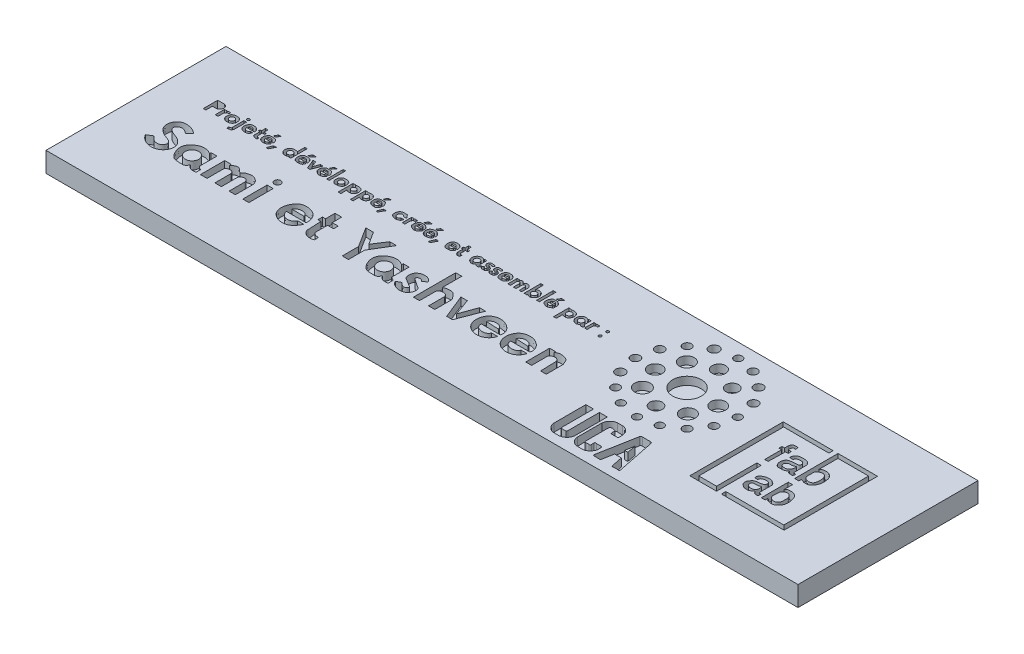
from build123d import *

# Parameters (mm, degrees)
ESQUISSE1_W             = 188
ESQUISSE1_H             = 45
BOSS_EXTRU_1_DEPTH      = 5
ESQUISSE2_R             = 1.003494423
ESQUISSE2_R_2           = 1.254368028
ESQUISSE2_R_3           = 1.066212824
ESQUISSE2_R_4           = 1.128931226
ESQUISSE2_R_5           = 1.191649627
ESQUISSE2_R_6           = 1.75611524
ESQUISSE2_R_7           = 1.944270444
ESQUISSE2_R_8           = 1.844603525
ESQUISSE2_R_9           = 1.572969505
ESQUISSE2_R_10          = 1.68874464
ESQUISSE2_R_11          = 1.864752134
ESQUISSE2_R_12          = 1.095329792
ESQUISSE2_R_13          = 1.153063781
ESQUISSE2_R_14          = 1.151356801
ESQUISSE2_R_15          = 3.575499
ESQUISSE2_R_16          = 1.567960035
ESQUISSE2_R_17          = 0.336808737
ESQUISSE2_R_18          = 0.343946288
ESQUISSE2_R_19          = 0.360003445
ESQUISSE2_R_20          = 0.807003803
ESQUISSE2_R_21          = 0.647713968
ESQUISSE2_R_22          = 0.647697021
ESQUISSE2_R_23          = 0.674645357
ESQUISSE2_W             = 0.60717921
ESQUISSE2_H             = 4.133695843
ESQUISSE2_R_24          = 0.594357266
ESQUISSE2_R_25          = 0.605764792
ESQUISSE2_R_26          = 0.686375315
ESQUISSE2_R_27          = 0.654240709
ESQUISSE2_W_2           = 0.684768743
ESQUISSE2_H_2           = 4.142477099
ESQUISSE2_R_28          = 0.651545514
ESQUISSE2_R_29          = 1.68492656
ESQUISSE2_W_3           = 1.518261404
ESQUISSE2_H_3           = 6.0737923
ENL_V_MAT_EXTRU_1_DEPTH = 2


with BuildPart() as part:
    # Esquisse1 → Boss.-Extru.1 (new body)
    with BuildSketch(Plane(origin=(0, 0, 0), x_dir=(1, 0, 0), z_dir=(0, 1, 0))):
        Rectangle(ESQUISSE1_W, ESQUISSE1_H)
    extrude(amount=BOSS_EXTRU_1_DEPTH)

    # Esquisse2 → Enlèv. mat.-Extru.1 (cut)
    # profile 1 of 95: a face of its own
    with BuildSketch(Plane(origin=(0, 5, 0), x_dir=(1, 0, 0), z_dir=(0, 1, 0))):
        with Locations((37.569368177, 18.997755936)):
            Circle(ESQUISSE2_R)
    # profile 2 of 95: a face of its own
    with BuildSketch(Plane(origin=(0, 5, 0), x_dir=(1, 0, 0), z_dir=(0, 1, 0))):
        with Locations((32.551896064, 17.994261513)):
            Circle(ESQUISSE2_R_2)
    # profile 3 of 95: a face of its own
    with BuildSketch(Plane(origin=(0, 5, 0), x_dir=(1, 0, 0), z_dir=(0, 1, 0))):
        with Locations((28.537918373, 15.234651851)):
            Circle(ESQUISSE2_R_3)
    # profile 4 of 95: a face of its own
    with BuildSketch(Plane(origin=(0, 5, 0), x_dir=(1, 0, 0), z_dir=(0, 1, 0))):
        with Locations((25.778308711, 11.157955758)):
            Circle(ESQUISSE2_R_4)
    # profile 5 of 95: a face of its own
    with BuildSketch(Plane(origin=(0, 5, 0), x_dir=(1, 0, 0), z_dir=(0, 1, 0))):
        with Locations((24.649377485, 6.203202047)):
            Circle(ESQUISSE2_R_4)
    # profile 6 of 95: a face of its own
    with BuildSketch(Plane(origin=(0, 5, 0), x_dir=(1, 0, 0), z_dir=(0, 1, 0))):
        with Locations((25.778308711, 1.311166736)):
            Circle(ESQUISSE2_R_5)
    # profile 7 of 95: a face of its own
    with BuildSketch(Plane(origin=(0, 5, 0), x_dir=(1, 0, 0), z_dir=(0, 1, 0))):
        with Locations((28.537918373, -2.640092553)):
            Circle(ESQUISSE2_R_3)
    # profile 8 of 95: a face of its own
    with BuildSketch(Plane(origin=(0, 5, 0), x_dir=(1, 0, 0), z_dir=(0, 1, 0))):
        with Locations((29.604131197, 6.203202047)):
            Circle(ESQUISSE2_R_6)
    # profile 9 of 95: a face of its own
    with BuildSketch(Plane(origin=(0, 5, 0), x_dir=(1, 0, 0), z_dir=(0, 1, 0))):
        with Locations((31.924712049, 0.683982722)):
            Circle(ESQUISSE2_R_7)
    # profile 10 of 95: a face of its own
    with BuildSketch(Plane(origin=(0, 5, 0), x_dir=(1, 0, 0), z_dir=(0, 1, 0))):
        with Locations((32.551896064, -5.336983814)):
            Circle(ESQUISSE2_R)
    # profile 11 of 95: a face of its own
    with BuildSketch(Plane(origin=(0, 5, 0), x_dir=(1, 0, 0), z_dir=(0, 1, 0))):
        with Locations((37.569368177, -6.340478237)):
            Circle(ESQUISSE2_R)
    # profile 12 of 95: a face of its own
    with BuildSketch(Plane(origin=(0, 5, 0), x_dir=(1, 0, 0), z_dir=(0, 1, 0))):
        with Locations((42.273248283, -5.336983814)):
            Circle(ESQUISSE2_R)
    # profile 13 of 95: a face of its own
    with BuildSketch(Plane(origin=(0, 5, 0), x_dir=(1, 0, 0), z_dir=(0, 1, 0))):
        with Locations((46.412662777, -2.640092553)):
            Circle(ESQUISSE2_R_3)
    # profile 14 of 95: a face of its own
    with BuildSketch(Plane(origin=(0, 5, 0), x_dir=(1, 0, 0), z_dir=(0, 1, 0))):
        with Locations((49.172272439, 1.311166736)):
            Circle(ESQUISSE2_R_3)
    # profile 15 of 95: a face of its own
    with BuildSketch(Plane(origin=(0, 5, 0), x_dir=(1, 0, 0), z_dir=(0, 1, 0))):
        with Locations((50.238485263, 6.203202047)):
            Circle(ESQUISSE2_R)
    # profile 16 of 95: a face of its own
    with BuildSketch(Plane(origin=(0, 5, 0), x_dir=(1, 0, 0), z_dir=(0, 1, 0))):
        with Locations((45.346449953, 6.203202047)):
            Circle(ESQUISSE2_R_8)
    # profile 17 of 95: a face of its own
    with BuildSketch(Plane(origin=(0, 5, 0), x_dir=(1, 0, 0), z_dir=(0, 1, 0))):
        with Locations((43.276742706, 11.785139773)):
            Circle(ESQUISSE2_R_9)
    # profile 18 of 95: a face of its own
    with BuildSketch(Plane(origin=(0, 5, 0), x_dir=(1, 0, 0), z_dir=(0, 1, 0))):
        with Locations((37.569368177, 14.168439026)):
            Circle(ESQUISSE2_R_10)
    # profile 19 of 95: a face of its own
    with BuildSketch(Plane(origin=(0, 5, 0), x_dir=(1, 0, 0), z_dir=(0, 1, 0))):
        with Locations((31.924712049, 11.785139773)):
            Circle(ESQUISSE2_R_11)
    # profile 20 of 95: a face of its own
    with BuildSketch(Plane(origin=(0, 5, 0), x_dir=(1, 0, 0), z_dir=(0, 1, 0))):
        with Locations((42.273248283, 17.994261513)):
            Circle(ESQUISSE2_R_12)
    # profile 21 of 95: a face of its own
    with BuildSketch(Plane(origin=(0, 5, 0), x_dir=(1, 0, 0), z_dir=(0, 1, 0))):
        with Locations((46.412662777, 15.234651851)):
            Circle(ESQUISSE2_R_13)
    # profile 22 of 95: a face of its own
    with BuildSketch(Plane(origin=(0, 5, 0), x_dir=(1, 0, 0), z_dir=(0, 1, 0))):
        with Locations((49.23499084, 11.157955758)):
            Circle(ESQUISSE2_R_14)
    # profile 23 of 95: a face of its own
    with BuildSketch(Plane(origin=(0, 5, 0), x_dir=(1, 0, 0), z_dir=(0, 1, 0))):
        with Locations((37.569368177, 6.203202047)):
            Circle(ESQUISSE2_R_15)
    # profile 24 of 95: a face of its own
    with BuildSketch(Plane(origin=(0, 5, 0), x_dir=(1, 0, 0), z_dir=(0, 1, 0))):
        with Locations((37.569368177, -1.573879729)):
            Circle(ESQUISSE2_R_16)
    # profile 25 of 95: a face of its own
    with BuildSketch(Plane(origin=(0, 5, 0), x_dir=(1, 0, 0), z_dir=(0, 1, 0))):
        with Locations((43.276742706, 0.683982722)):
            Circle(ESQUISSE2_R_11)
    # profile 26 of 95: a face of its own
    with BuildSketch(Plane(origin=(0, 5, 0), x_dir=(1, 0, 0), z_dir=(0, 1, 0))):
        with Locations((-75.35331491, 9.45946145)):
            Circle(ESQUISSE2_R_17)
    # profile 27 of 95: a face of its own
    with BuildSketch(Plane(origin=(0, 5, 0), x_dir=(1, 0, 0), z_dir=(0, 1, 0))):
        with Locations((15.466986725, 8.442501589)):
            Circle(ESQUISSE2_R_18)
    # profile 28 of 95: a face of its own
    with BuildSketch(Plane(origin=(0, 5, 0), x_dir=(1, 0, 0), z_dir=(0, 1, 0))):
        with Locations((15.466986725, 6.577700696)):
            Circle(ESQUISSE2_R_19)
    # profile 29 of 95: a face of its own
    with BuildSketch(Plane(origin=(0, 5, 0), x_dir=(1, 0, 0), z_dir=(0, 1, 0))):
        with Locations((-58.117217014, -0.488564458)):
            Circle(ESQUISSE2_R_20)
    # profile 30 of 95: a face of its own
    with BuildSketch(Plane(origin=(0, 5, 0), x_dir=(1, 0, 0), z_dir=(0, 1, 0))):
        with BuildLine():
            add(Edge.make_bspline(
                [(-78.840433233, 7.527066161), (-78.818820083, 7.794858348), (-78.72358438, 8.380259296), (-78.082246707, 8.744513917), (-77.628182805, 8.725684645), (-77.311185233, 8.726782568), (-76.914092987, 8.74546632), (-76.579766513, 8.482424145), (-76.287798125, 8.111571361), (-76.198871006, 7.598727523), (-76.243119367, 7.042042492), (-76.536107563, 6.610776023), (-76.902889052, 6.393802679), (-77.224499525, 6.297035315), (-77.487900555, 6.310758802), (-77.769342626, 6.303424823), (-78.13522426, 6.377658327), (-78.478202325, 6.607068574), (-78.729812126, 6.941287788), (-78.857930761, 7.244822102), (-78.847181309, 7.443455865), (-78.840433233, 7.527066161)],
                knots=[0, 0, 0, 0, 0.097975938, 0.208057677, 0.230698468, 0.266401254, 0.326756145, 0.370251693, 0.417803028, 0.499835107, 0.555228924, 0.621889193, 0.683171834, 0.710259062, 0.745101932, 0.779944801, 0.814652398, 0.881937913, 0.926653093, 0.969409872, 1, 1, 1, 1], degree=3))
        make_face()
        with Locations((-77.540742679, 7.527066161)):
            Circle(ESQUISSE2_R_21, mode=Mode.SUBTRACT)
    # profile 31 of 95: a face of its own
    with BuildSketch(Plane(origin=(0, 5, 0), x_dir=(1, 0, 0), z_dir=(0, 1, 0))):
        with BuildLine():
            add(Edge.make_bspline(
                [(-51.507517272, 7.527066161), (-51.495466711, 7.704826332), (-51.486478802, 8.06919504), (-51.107131767, 8.424544884), (-50.78723419, 8.77335401), (-50.387591193, 8.71216966), (-50.0120227, 8.756261609), (-49.619642402, 8.622067708), (-49.141560218, 8.456127296), (-48.995301821, 7.974868802), (-48.871506218, 7.511518795), (-48.985070771, 7.074985572), (-49.110925487, 6.611643635), (-49.527146242, 6.507459396), (-49.850854749, 6.331397312), (-50.290538661, 6.401680132), (-50.766658553, 6.289824117), (-51.166152689, 6.605944581), (-51.389982499, 6.918042691), (-51.532666391, 7.230067897), (-51.514213936, 7.428282363), (-51.507517272, 7.527066161)],
                knots=[0, 0, 0, 0, 0.064686994, 0.128088116, 0.189028157, 0.224645051, 0.270737503, 0.329112846, 0.378081359, 0.449212661, 0.49947226, 0.55548861, 0.617742159, 0.657779614, 0.705610134, 0.752148909, 0.818746152, 0.876684955, 0.926431525, 0.964052538, 1, 1, 1, 1], degree=3))
        make_face()
        with Locations((-50.236736026, 7.527066161)):
            Circle(ESQUISSE2_R_22, mode=Mode.SUBTRACT)
    # profile 32 of 95: a face of its own
    with BuildSketch(Plane(origin=(0, 5, 0), x_dir=(1, 0, 0), z_dir=(0, 1, 0))):
        with BuildLine():
            Line((28.537918373, -10.064511424), (30.450343857, -10.064511424))
            Line((30.450343857, -10.064511424), (30.450343857, -17.986601059))
            add(Edge.make_bspline(
                [(30.450343857, -17.986601059), (30.4364533, -18.250747737), (30.701407569, -18.288951952)],
                knots=[0, 0, 0, 1, 1, 1], degree=2))
            Line((30.701407569, -18.288951952), (31.754040967, -18.288951952))
            add(Edge.make_bspline(
                [(31.924712049, -17.986601059), (31.938505779, -18.200895217), (31.754040967, -18.288951952)],
                knots=[0, 0, 0, 1, 1, 1], degree=2))
            Line((31.924712049, -17.986601059), (31.924712049, -10.064511424))
            Line((31.924712049, -10.064511424), (33.893277328, -10.064511424))
            Line((33.893277328, -10.064511424), (33.893277328, -17.986601059))
            add(Edge.make_bspline(
                [(33.893277328, -17.986601059), (33.959164661, -19.08257763), (32.97867888, -20.052423779), (31.924712049, -20.159326065)],
                knots=[0, 0, 0, 0, 1, 1, 1, 1], degree=3))
            Line((31.924712049, -20.159326065), (30.450343857, -20.159326065))
            add(Edge.make_bspline(
                [(28.537918373, -17.986601059), (28.579979043, -19.018543488), (29.389845526, -20.045041062), (30.450343857, -20.159326065)],
                knots=[0, 0, 0, 0, 1, 1, 1, 1], degree=3))
            Line((28.537918373, -17.986601059), (28.537918373, -10.064511424))
        make_face()
    # profile 33 of 95: a face of its own
    with BuildSketch(Plane(origin=(0, 5, 0), x_dir=(1, 0, 0), z_dir=(0, 1, 0))):
        with BuildLine():
            Line((38.254288761, -13.220903167), (39.305496072, -13.220903167))
            add(Edge.make_bspline(
                [(37.738241536, -10.064511424), (38.51370932, -10.106201597), (39.651027547, -10.927146513), (39.753621122, -12.260078086), (39.780973433, -12.967776485), (39.679265766, -13.362413494), (39.305496072, -13.220903167)],
                knots=[0, 0, 0, 0, 0.519670095, 0.764782542, 0.855055388, 1, 1, 1, 1], degree=3))
            Line((37.738241536, -10.064511424), (36.400341322, -10.064511424))
            add(Edge.make_bspline(
                [(36.400341322, -10.064511424), (35.384224186, -10.102098774), (34.658291363, -11.067815824), (34.508168163, -11.997680114)],
                knots=[0, 0, 0, 0, 1, 1, 1, 1], degree=3))
            Line((34.508168163, -11.997680114), (34.508168163, -18.190246818))
            add(Edge.make_bspline(
                [(34.508168163, -18.190246818), (34.514106665, -18.75309618), (35.065528304, -19.623009096), (35.933978216, -20.136468445), (36.400341322, -20.159326065)],
                knots=[0, 0, 0, 0, 0.545261745, 1, 1, 1, 1], degree=3))
            Line((36.400341322, -20.159326065), (37.738241536, -20.159326065))
            add(Edge.make_bspline(
                [(39.760906697, -18.288951952), (39.707876295, -18.877701827), (39.088210541, -19.689238686), (38.199177768, -20.213433622), (37.738241536, -20.159326065)],
                knots=[0, 0, 0, 0, 0.561730255, 1, 1, 1, 1], degree=3))
            Line((39.760906697, -18.288951952), (39.760906697, -17.447716264))
            add(Edge.make_bspline(
                [(39.305496072, -17.177265227), (39.661528944, -17.114587207), (39.760906697, -17.447716264)],
                knots=[0, 0, 0, 1, 1, 1], degree=2))
            Line((39.305496072, -17.177265227), (38.254288761, -17.177265227))
            add(Edge.make_bspline(
                [(38.254288761, -17.177265227), (37.829805801, -17.020068502), (37.864880385, -17.447716264)],
                knots=[0, 0, 0, 1, 1, 1], degree=2))
            Line((37.864880385, -17.447716264), (37.864880385, -17.986601059))
            add(Edge.make_bspline(
                [(37.569368177, -18.288951952), (37.961458318, -18.313768891), (37.864880385, -17.986601059)],
                knots=[0, 0, 0, 1, 1, 1], degree=2))
            Line((37.569368177, -18.288951952), (36.823640765, -18.288951952))
            add(Edge.make_bspline(
                [(36.400341322, -17.865328194), (36.34768159, -18.3254903), (36.823640765, -18.288951952)],
                knots=[0, 0, 0, 1, 1, 1], degree=2))
            Line((36.400341322, -17.865328194), (36.400341322, -12.265260157))
            add(Edge.make_bspline(
                [(38.254288761, -13.220903167), (37.855159043, -13.309767534), (37.907223281, -12.881010531), (37.810231306, -12.473229717), (37.922914423, -12.106908245), (37.198014723, -11.876731089), (36.54330767, -11.754393822), (36.400341322, -12.265260157)],
                knots=[0, 0, 0, 0, 0.244596904, 0.33410296, 0.449883371, 0.553468519, 1, 1, 1, 1], degree=3))
        make_face()
    # profile 34 of 95: a face of its own
    with BuildSketch(Plane(origin=(0, 5, 0), x_dir=(1, 0, 0), z_dir=(0, 1, 0))):
        with BuildLine():
            Line((42.167783862, -10.313604193), (40.438923139, -19.698763318))
            add(Edge.make_bspline(
                [(40.438923139, -19.698763318), (40.315111389, -20.214766145), (40.817448006, -20.159326065)],
                knots=[0, 0, 0, 1, 1, 1], degree=2))
            Line((40.817448006, -20.159326065), (41.970877095, -20.159326065))
            add(Edge.make_bspline(
                [(42.321520296, -19.966675886), (42.229610568, -20.236279951), (41.970877095, -20.159326065)],
                knots=[0, 0, 0, 1, 1, 1], degree=2))
            Line((42.321520296, -19.966675886), (42.835363745, -17.177265227))
            Line((42.835363745, -17.177265227), (44.512872169, -17.177265227))
            Line((44.512872169, -17.177265227), (45.077747454, -19.966675886))
            add(Edge.make_bspline(
                [(45.077747454, -19.966675886), (45.172027145, -20.278393346), (45.499684902, -20.154753957)],
                knots=[0, 0, 0, 1, 1, 1], degree=2))
            Line((45.499684902, -20.154753957), (46.618853721, -20.154753957))
            add(Edge.make_bspline(
                [(47.032562395, -19.966675886), (46.972289759, -20.297784346), (46.618853721, -20.154753957)],
                knots=[0, 0, 0, 1, 1, 1], degree=2))
            Line((47.032562395, -19.966675886), (45.077747454, -10.313604193))
            add(Edge.make_bspline(
                [(44.512872169, -10.007737335), (44.90998313, -9.952301581), (45.077747454, -10.313604193)],
                knots=[0, 0, 0, 1, 1, 1], degree=2))
            Line((44.512872169, -10.007737335), (42.575089478, -10.007737335))
            add(Edge.make_bspline(
                [(42.575089478, -10.007737335), (42.200203306, -9.948098326), (42.167783862, -10.313604193)],
                knots=[0, 0, 0, 1, 1, 1], degree=2))
        make_face()
        Polygon((43.674117957, -12.894306673), (43.276742706, -15.14014004), (44.102053779, -15.14014004), align=None, mode=Mode.SUBTRACT)
    # profile 35 of 95: a face of its own
    with BuildSketch(Plane(origin=(0, 5, 0), x_dir=(1, 0, 0), z_dir=(0, 1, 0))):
        with BuildLine():
            Line((71.69033937, 5.075194262), (71.69033937, 9.806535876))
            Line((71.69033937, 9.806535876), (79.339144755, 9.806535876))
            Line((79.339144755, 9.806535876), (79.339144755, -11.393285843))
            Line((79.339144755, -11.393285843), (64.843556488, -11.393285843))
            Line((64.843556488, -11.393285843), (64.843556488, -12.486134342))
            Line((64.843556488, -12.486134342), (80.505267427, -12.486134342))
            Line((80.505267427, -12.486134342), (80.505267427, 10.870105248))
            Line((80.505267427, 10.870105248), (70.633193707, 10.870105248))
            Line((70.633193707, 10.870105248), (70.633193707, 0.033091992))
            Line((70.633193707, 0.033091992), (71.69033937, 0.033091992))
            Line((71.69033937, 0.033091992), (71.69033937, 0.683982722))
            add(Edge.make_bspline(
                [(71.69033937, 5.075194262), (72.243130163, 5.548125209), (73.602363119, 5.759108408), (74.827645763, 4.670570383), (75.015574716, 3.704369036), (75.083893312, 2.892440132), (75.011873239, 2.012136189), (74.559690793, 0.976855031), (73.341661539, -0.004202519), (72.199790728, 0.449087201), (71.69033937, 0.683982722)],
                knots=[0, 0, 0, 0, 0.212929357, 0.347180218, 0.436164846, 0.495781264, 0.587684775, 0.692014835, 0.823977695, 1, 1, 1, 1], degree=3))
        make_face()
        with BuildLine():
            Line((71.69033937, 3.943068258), (71.69033937, 1.895860957))
            add(Edge.make_bspline(
                [(71.69033937, 3.943068258), (72.017851242, 4.314246969), (73.097304302, 5.078150155), (74.081744365, 4.053104467), (74.201862834, 3.188616015), (74.271951241, 2.296392873), (73.969205133, 1.192900008), (72.62240354, 0.958840328), (71.922066777, 1.482326149), (71.69033937, 1.895860957)],
                knots=[0, 0, 0, 0, 0.222724787, 0.354516142, 0.450085262, 0.550434116, 0.699969949, 0.821126667, 1, 1, 1, 1], degree=3))
        make_face(mode=Mode.SUBTRACT)
    # profile 36 of 95: a face of its own
    with BuildSketch(Plane(origin=(0, 5, 0), x_dir=(1, 0, 0), z_dir=(0, 1, 0))):
        with BuildLine():
            Line((71.69033937, -3.687389187), (71.69033937, -1.573879729))
            Line((71.69033937, -1.573879729), (70.633193707, -1.573879729))
            Line((70.633193707, -1.573879729), (70.633193707, -8.303870959))
            Line((70.633193707, -8.303870959), (71.605189968, -8.303870959))
            Line((71.605189968, -8.303870959), (71.605189968, -7.890351852))
            add(Edge.make_bspline(
                [(71.69033937, -3.687389187), (71.941412536, -3.255868864), (72.640175206, -3.128655346), (73.609965049, -3.213362426), (74.346514383, -3.627390651), (74.823580731, -4.327608225), (74.957120191, -5.040251054), (75.084722321, -5.696263057), (75.082642812, -6.443113431), (74.884698577, -7.290467551), (74.234648803, -7.899917791), (73.583885206, -8.383223695), (72.827984844, -8.312011917), (72.309462596, -8.222815913), (71.760542646, -8.035515411), (71.92011869, -7.588951135), (71.434695446, -7.711254566), (71.605189968, -7.890351852)],
                knots=[0, 0, 0, 0, 0.120892036, 0.188702957, 0.270434685, 0.347741076, 0.417437247, 0.471640483, 0.534389894, 0.626473157, 0.70327487, 0.779966871, 0.843621677, 0.900978605, 0.946508574, 0.962578485, 1, 1, 1, 1], degree=3))
        make_face()
        with BuildLine():
            Line((71.69033937, -4.823418474), (71.605189968, -6.58087468))
            add(Edge.make_bspline(
                [(71.69033937, -4.823418474), (71.828563227, -4.396030995), (72.372392797, -4.012890949), (73.319976979, -3.933679551), (73.748064307, -4.471538287), (74.075128449, -4.967523757), (74.01306243, -5.458207433), (74.018002256, -5.930051377), (74.06871259, -6.485484438), (73.810701662, -7.077220727), (73.348377439, -7.532853987), (72.753253434, -7.479286187), (72.093934515, -7.31300922), (71.741433781, -6.857049651), (71.605189968, -6.58087468)],
                knots=[0, 0, 0, 0, 0.158857754, 0.23943607, 0.328126987, 0.398917471, 0.457580078, 0.507551929, 0.579406853, 0.66387429, 0.746845361, 0.800626976, 0.880336187, 1, 1, 1, 1], degree=3))
        make_face(mode=Mode.SUBTRACT)
    # profile 37 of 95: a face of its own
    with BuildSketch(Plane(origin=(0, 5, 0), x_dir=(1, 0, 0), z_dir=(0, 1, 0))):
        Polygon((69.400834611, 10.870105248), (69.400834611, 9.806535876), (58.090267517, 9.806535876), (58.090267517, -11.393285843), (62.532603564, -11.393285843), (62.532603564, -1.318849497), (63.615911068, -1.318849497), (63.615911068, -12.486134342), (56.937389481, -12.486134342), (56.937389481, 10.870105248), align=None)
    # profile 38 of 95: a face of its own
    with BuildSketch(Plane(origin=(0, 5, 0), x_dir=(1, 0, 0), z_dir=(0, 1, 0))):
        with BuildLine():
            Line((63.615911068, 7.179101797), (64.393075745, 7.179101797))
            Line((64.393075745, 7.179101797), (64.393075745, 6.386991646))
            add(Edge.make_bspline(
                [(64.393075745, 6.386991646), (63.988886737, 6.657142794), (63.507789192, 6.160538853), (63.617777446, 5.635352374), (63.615911068, 5.448277224)],
                knots=[0, 0, 0, 0, 0.636530583, 1, 1, 1, 1], degree=3))
            Line((63.615911068, 5.448277224), (64.393075745, 5.448277224))
            Line((64.393075745, 5.448277224), (64.393075745, 4.653904127))
            Line((64.393075745, 4.653904127), (63.713841528, 4.653904127))
            Line((63.713841528, 4.653904127), (63.615911068, 0.411657241))
            Line((63.615911068, 0.411657241), (62.764019018, 0.411657241))
            Line((62.764019018, 0.411657241), (62.764019018, 4.653904127))
            Line((62.764019018, 4.653904127), (62.087736127, 4.653904127))
            Line((62.087736127, 4.653904127), (62.087736127, 5.401641853))
            Line((62.087736127, 5.401641853), (62.764019018, 5.401641853))
            Line((62.764019018, 5.401641853), (62.764019018, 6.372046171))
            add(Edge.make_bspline(
                [(63.615911068, 7.179101797), (62.86430307, 7.12320451), (62.764019018, 6.372046171)],
                knots=[0, 0, 0, 1, 1, 1], degree=2))
        make_face()
    # profile 39 of 95: a face of its own
    with BuildSketch(Plane(origin=(0, 5, 0), x_dir=(1, 0, 0), z_dir=(0, 1, 0))):
        with BuildLine():
            Line((69.24503862, -4.272059665), (69.24503862, -7.287303154))
            add(Edge.make_bspline(
                [(66.337623405, -4.823418474), (66.184339937, -4.382588448), (66.702360015, -4.010632099), (67.444172893, -3.886476203), (68.125034589, -3.920073774), (68.459637577, -4.48135538), (68.312833922, -5.102689573), (67.72577827, -5.182429352), (67.279642343, -5.375537222), (66.780189823, -5.297309694), (66.3419771, -5.50353895), (65.776039096, -5.594964633), (65.535754519, -6.132392673), (65.12389569, -6.52475884), (65.196562387, -7.082949676), (65.272948168, -7.624228181), (65.792427489, -7.963898532), (66.259023661, -8.331275096), (66.868387202, -8.329250862), (67.436070016, -8.392633781), (67.907119644, -8.058337911), (68.410262385, -7.498930121), (68.666446507, -7.932572203), (68.82539723, -8.247046842), (69.23241019, -8.267075184), (69.626840174, -8.387095497), (69.880573196, -8.025287436), (69.804860551, -7.785104671), (69.873179248, -7.495154083), (69.468629728, -7.643955606), (69.33729529, -7.401858517), (69.24503862, -7.287303154)],
                knots=[0, 0, 0, 0, 0.070611284, 0.114160431, 0.159863104, 0.19858182, 0.23446945, 0.270880148, 0.308813325, 0.33560483, 0.370952794, 0.408254413, 0.445272627, 0.485168854, 0.518484343, 0.555517427, 0.59317277, 0.640473934, 0.67463793, 0.717399758, 0.751106574, 0.801484022, 0.817873225, 0.842939171, 0.870912305, 0.895947726, 0.921336591, 0.941563852, 0.952272403, 0.967616859, 1, 1, 1, 1], degree=3))
            Line((66.337623405, -4.823418474), (65.512722137, -4.823418474))
            add(Edge.make_bspline(
                [(65.512722137, -4.823418474), (65.263705257, -4.225579248), (65.850574011, -3.585192503), (66.771586501, -3.213308986), (67.497082155, -3.16371566), (68.190644724, -3.132536156), (68.741753853, -3.684016672), (69.232635986, -3.883365357), (69.24503862, -4.272059665)],
                knots=[0, 0, 0, 0, 0.293741776, 0.444753161, 0.564312561, 0.717547497, 0.812223352, 1, 1, 1, 1], degree=3))
        make_face()
        with BuildLine():
            add(Edge.make_bspline(
                [(68.242210683, -5.874446205), (68.151591007, -5.838156858), (67.709146688, -6.119182152), (67.127535042, -6.105303048), (66.339045971, -6.055304729), (65.977748503, -6.748490081), (66.343770348, -7.288065207), (66.968788903, -7.554123895), (67.694318478, -7.606975699), (68.272501366, -7.137473898), (68.393727704, -6.659277179), (68.386944546, -6.278875293), (68.353132897, -5.91886586), (68.242210683, -5.874446205)],
                knots=[0, 0, 0, 0, 0.062371959, 0.184540586, 0.303825622, 0.385677873, 0.493751113, 0.562342981, 0.706527524, 0.807194781, 0.886001195, 0.923654154, 1, 1, 1, 1], degree=3))
        make_face(mode=Mode.SUBTRACT)
    # profile 40 of 95: a face of its own
    with BuildSketch(Plane(origin=(0, 5, 0), x_dir=(1, 0, 0), z_dir=(0, 1, 0))):
        with BuildLine():
            Line((69.24503862, 4.483303518), (69.24503862, 1.311166736))
            add(Edge.make_bspline(
                [(66.337623405, 3.943068258), (66.352980902, 4.482589123), (67.179356975, 4.706259553), (68.198159803, 4.643015783), (68.530394609, 4.010205067), (68.390516393, 3.405746843), (67.866394078, 3.411989004), (67.38494597, 3.368132771), (66.7806707, 3.293252761), (66.093910993, 3.276683278), (65.439177194, 2.891291317), (65.23402991, 2.272671792), (65.162958563, 1.669281529), (65.28250043, 1.173973198), (65.55529391, 0.690019253), (66.020163723, 0.343278336), (66.637222416, 0.443883382), (67.202733124, 0.34422442), (67.742594809, 0.61402083), (68.158229342, 0.6425685), (68.423074392, 1.05862171), (68.460742195, 0.663607263), (68.643513319, 0.525962419), (68.89249625, 0.35372944), (69.227777762, 0.448052572), (69.674524104, 0.330082703), (69.844962661, 0.723753942), (69.855793749, 1.146917805), (69.482853446, 1.074994015), (69.28529125, 1.080479313), (69.24503862, 1.311166736)],
                knots=[0, 0, 0, 0, 0.093798825, 0.153449542, 0.195416607, 0.227830087, 0.260399727, 0.289260638, 0.332504456, 0.385948701, 0.43175706, 0.479709038, 0.515160753, 0.558421499, 0.582487416, 0.631426961, 0.665620872, 0.70912885, 0.747920176, 0.785439394, 0.799478666, 0.819114283, 0.83365526, 0.850710226, 0.877929706, 0.903096477, 0.934246141, 0.955274501, 0.968510854, 1, 1, 1, 1], degree=3))
            Line((66.337623405, 3.943068258), (65.512722137, 3.943068258))
            add(Edge.make_bspline(
                [(65.512722137, 3.943068258), (65.263843128, 4.685993972), (66.179192894, 5.534686436), (67.263656245, 5.430027234), (68.232550764, 5.517302257), (69.072754773, 5.093161722), (69.24503862, 4.483303518)],
                knots=[0, 0, 0, 0, 0.419645664, 0.520374376, 0.648574556, 1, 1, 1, 1], degree=3))
        make_face()
        with BuildLine():
            add(Edge.make_bspline(
                [(68.321568486, 2.848347571), (68.212244616, 2.88752611), (67.621069622, 2.387385982), (66.968949944, 2.623561817), (66.484886866, 2.440393807), (66.219465766, 2.198394555), (66.090920308, 2.033819452), (66.032783598, 1.700130685), (66.15067789, 1.179292569), (66.833253279, 1.098530795), (67.502068229, 1.024076372), (68.136937183, 1.457074285), (68.343645715, 2.055540325), (68.458144814, 2.799402532), (68.321568486, 2.848347571)],
                knots=[0, 0, 0, 0, 0.09475534, 0.234590437, 0.308401092, 0.324036386, 0.383509269, 0.400064653, 0.482156107, 0.581282139, 0.675086373, 0.792994691, 0.881623873, 1, 1, 1, 1], degree=3))
        make_face(mode=Mode.SUBTRACT)
    # profile 41 of 95: a face of its own
    with BuildSketch(Plane(origin=(0, 5, 0), x_dir=(1, 0, 0), z_dir=(0, 1, 0))):
        with BuildLine():
            Line((-83.379663705, 9.806535876), (-83.379663705, 6.203202047))
            Line((-83.379663705, 6.203202047), (-82.744232549, 6.203202047))
            Line((-82.744232549, 6.203202047), (-82.744232549, 7.849331478))
            Line((-82.744232549, 7.849331478), (-81.565432244, 7.849331478))
            add(Edge.make_bspline(
                [(-81.69211172, 9.806535876), (-81.217429085, 9.767353985), (-80.578858163, 8.871266782), (-81.17873673, 8.018557221), (-81.565432244, 7.849331478)],
                knots=[0, 0, 0, 0, 0.510948488, 1, 1, 1, 1], degree=3))
            Line((-81.69211172, 9.806535876), (-83.379663705, 9.806535876))
        make_face()
    # profile 42 of 95: a face of its own
    with BuildSketch(Plane(origin=(0, 5, 0), x_dir=(1, 0, 0), z_dir=(0, 1, 0))):
        with BuildLine():
            Line((-80.546353879, 8.682086152), (-80.546353879, 6.372046171))
            Line((-80.546353879, 6.372046171), (-79.858856492, 6.372046171))
            Line((-79.858856492, 6.372046171), (-79.858856492, 7.527066161))
            add(Edge.make_bspline(
                [(-79.024038237, 8.289230502), (-79.480647748, 8.398220638), (-79.853092049, 7.945237533), (-79.858856492, 7.527066161)],
                knots=[0, 0, 0, 0, 1, 1, 1, 1], degree=3))
            Line((-79.024038237, 8.289230502), (-79.024038237, 8.682086152))
            add(Edge.make_bspline(
                [(-79.024038237, 8.682086152), (-79.500532779, 8.860173668), (-79.858856492, 8.481048828)],
                knots=[0, 0, 0, 1, 1, 1], degree=2))
            Line((-79.858856492, 8.481048828), (-79.858856492, 8.682086152))
            Line((-79.858856492, 8.682086152), (-80.546353879, 8.682086152))
        make_face()
    # profile 43 of 95: a face of its own
    with BuildSketch(Plane(origin=(0, 5, 0), x_dir=(1, 0, 0), z_dir=(0, 1, 0))):
        with BuildLine():
            Line((-75.692614767, 8.682086152), (-75.692614767, 5.759281714))
            add(Edge.make_bspline(
                [(-75.692614767, 5.759281714), (-75.564144002, 5.467326213), (-76.078743307, 5.393470571), (-76.22022174, 5.478572203)],
                knots=[0, 0, 0, 0, 1, 1, 1, 1], degree=3))
            Line((-76.22022174, 5.478572203), (-76.22022174, 4.934543077))
            add(Edge.make_bspline(
                [(-75.022785081, 5.593545761), (-75.076579215, 5.434143079), (-75.181589905, 4.999970685), (-75.754232599, 5.012254616), (-76.026633086, 4.872152441), (-76.22022174, 4.934543077)],
                knots=[0, 0, 0, 0, 0.385781958, 0.652112477, 1, 1, 1, 1], degree=3))
            Line((-75.022785081, 5.593545761), (-75.022785081, 8.682086152))
            Line((-75.022785081, 8.682086152), (-75.692614767, 8.682086152))
        make_face()
    # profile 44 of 95: a face of its own
    with BuildSketch(Plane(origin=(0, 5, 0), x_dir=(1, 0, 0), z_dir=(0, 1, 0))):
        with BuildLine():
            Line((-71.963349599, 7.527066161), (-73.859256245, 7.527066161))
            add(Edge.make_bspline(
                [(-72.58604926, 7.179101797), (-72.631169774, 6.90591659), (-73.079421425, 6.729111692), (-73.700392879, 6.927345121), (-73.860838094, 7.316787849), (-73.859256245, 7.527066161)],
                knots=[0, 0, 0, 0, 0.40231084, 0.651709183, 1, 1, 1, 1], degree=3))
            Line((-72.58604926, 7.179101797), (-71.963349599, 7.179101797))
            add(Edge.make_bspline(
                [(-71.963349599, 7.527066161), (-71.876297154, 7.829972131), (-72.104466596, 8.351130566), (-72.611176815, 8.682776563), (-72.960497274, 8.81100528), (-73.186241984, 8.772205994), (-73.394827422, 8.814605228), (-73.653356519, 8.769380135), (-73.941314903, 8.717034289), (-74.211965258, 8.456574307), (-74.448188252, 8.111387322), (-74.537807114, 7.570648891), (-74.479152241, 6.93525254), (-73.997103984, 6.419991141), (-73.355517668, 6.301514271), (-72.770029508, 6.235033828), (-72.195223628, 6.560550455), (-72.049011931, 6.957854906), (-71.963349599, 7.179101797)],
                knots=[0, 0, 0, 0, 0.113998867, 0.198518209, 0.228992686, 0.253433992, 0.284754862, 0.309351847, 0.354064107, 0.393831065, 0.449654759, 0.512494226, 0.600786148, 0.686276446, 0.760318814, 0.848237667, 0.905740507, 1, 1, 1, 1], degree=3))
        make_face()
        with BuildLine():
            Line((-72.703215607, 7.849331478), (-73.697410555, 7.849331478))
            add(Edge.make_bspline(
                [(-73.697410555, 7.849331478), (-73.649675956, 8.083631498), (-73.205486577, 8.379131687), (-72.724096918, 8.102740229), (-72.703215607, 7.849331478)],
                knots=[0, 0, 0, 0, 0.49554083, 1, 1, 1, 1], degree=3))
        make_face(mode=Mode.SUBTRACT)
    # profile 45 of 95: a face of its own
    with BuildSketch(Plane(origin=(0, 5, 0), x_dir=(1, 0, 0), z_dir=(0, 1, 0))):
        with BuildLine():
            Line((-71.28828986, 8.289230502), (-71.683308844, 8.289230502))
            Line((-71.683308844, 8.289230502), (-71.683308844, 8.682086152))
            Line((-71.683308844, 8.682086152), (-71.28828986, 8.682086152))
            Line((-71.28828986, 8.682086152), (-71.28828986, 9.668123697))
            Line((-71.28828986, 9.668123697), (-70.684788636, 9.668123697))
            Line((-70.684788636, 9.668123697), (-70.684788636, 8.682086152))
            Line((-70.684788636, 8.682086152), (-70.081287412, 8.682086152))
            Line((-70.081287412, 8.682086152), (-70.081287412, 8.289230502))
            Line((-70.081287412, 8.289230502), (-70.684788636, 8.289230502))
            Line((-70.684788636, 8.289230502), (-70.684788636, 7.179101797))
            add(Edge.make_bspline(
                [(-70.684788636, 7.179101797), (-70.657695777, 6.875218567), (-70.307890498, 6.828564329), (-70.081287412, 6.804236069)],
                knots=[0, 0, 0, 0, 1, 1, 1, 1], degree=3))
            Line((-70.081287412, 6.804236069), (-70.081287412, 6.372046171))
            add(Edge.make_bspline(
                [(-71.28828986, 6.804236069), (-71.215678394, 6.550440274), (-70.768646187, 6.336930011), (-70.31148207, 6.270477536), (-70.081287412, 6.372046171)],
                knots=[0, 0, 0, 0, 0.505905845, 1, 1, 1, 1], degree=3))
            Line((-71.28828986, 6.804236069), (-71.28828986, 8.289230502))
        make_face()
    # profile 46 of 95: a face of its own
    with BuildSketch(Plane(origin=(0, 5, 0), x_dir=(1, 0, 0), z_dir=(0, 1, 0))):
        Polygon((-68.23786549, 9.909524187), (-68.70969372, 9.075595223), (-68.23786549, 9.075595223), (-67.535609519, 9.909524187), align=None)
    # profile 47 of 95: a face of its own
    with BuildSketch(Plane(origin=(0, 5, 0), x_dir=(1, 0, 0), z_dir=(0, 1, 0))):
        with BuildLine():
            Line((-69.127578053, 7.434709225), (-67.241139213, 7.434709225))
            add(Edge.make_bspline(
                [(-67.241139213, 7.434709225), (-67.132709143, 7.75940021), (-67.319761002, 8.182310532), (-67.738542184, 8.654908382), (-68.140793756, 8.685911331), (-68.448077568, 8.682284083), (-68.734890009, 8.677959709), (-69.020308182, 8.702413527), (-69.338493588, 8.616250946), (-69.538503313, 8.293259163), (-69.840614129, 7.951380964), (-69.81166184, 7.431202196), (-69.752900659, 6.963579568), (-69.436947716, 6.580412479), (-69.02398438, 6.34768718), (-68.639116054, 6.316961967), (-68.344615549, 6.304409642), (-68.093303896, 6.3832729), (-67.587073128, 6.48023996), (-67.348626642, 6.921157494), (-67.241139213, 7.179101797)],
                knots=[0, 0, 0, 0, 0.115947054, 0.176774068, 0.228935023, 0.263296073, 0.296337619, 0.338825684, 0.374243724, 0.415333312, 0.480052914, 0.543021208, 0.606013735, 0.65862331, 0.727336703, 0.782404449, 0.805788913, 0.840012296, 0.88306922, 1, 1, 1, 1], degree=3))
            Line((-67.241139213, 7.179101797), (-67.902476967, 7.179101797))
            add(Edge.make_bspline(
                [(-69.127578053, 7.434709225), (-69.11220099, 7.05089029), (-68.531580743, 6.726855505), (-67.970649027, 6.949277776), (-67.902476967, 7.179101797)],
                knots=[0, 0, 0, 0, 0.611719867, 1, 1, 1, 1], degree=3))
        make_face()
        with BuildLine():
            Line((-69.040845233, 7.849331478), (-68.010892992, 7.849331478))
            add(Edge.make_bspline(
                [(-69.040845233, 7.849331478), (-68.962440378, 8.333033751), (-67.997988167, 8.399864412), (-68.010892992, 7.849331478)],
                knots=[0, 0, 0, 0, 1, 1, 1, 1], degree=3))
        make_face(mode=Mode.SUBTRACT)
    # profile 48 of 95: a face of its own
    with BuildSketch(Plane(origin=(0, 5, 0), x_dir=(1, 0, 0), z_dir=(0, 1, 0))):
        Polygon((-66.547276651, 6.954919679), (-67.089356777, 5.593545761), (-66.547276651, 5.593545761), (-65.842572486, 6.954919679), align=None)
    # profile 49 of 95: a face of its own
    with BuildSketch(Plane(origin=(0, 5, 0), x_dir=(1, 0, 0), z_dir=(0, 1, 0))):
        with BuildLine():
            Line((-61.695989401, 6.372046171), (-61.695989401, 10.505742014))
            Line((-61.695989401, 10.505742014), (-62.290087319, 10.505742014))
            Line((-62.290087319, 10.505742014), (-62.290087319, 8.612088957))
            add(Edge.make_bspline(
                [(-62.290087319, 8.612088957), (-62.459263995, 8.684360538), (-62.773062253, 8.73441298), (-63.231276573, 8.745987807), (-63.671964137, 8.636369356), (-64.031521486, 8.3023619), (-64.333066795, 7.786657277), (-64.304332688, 7.113655133), (-63.92932849, 6.650557405), (-63.582406439, 6.348216816), (-63.209659749, 6.3030131), (-62.925710185, 6.328096304), (-62.560257468, 6.261062504), (-62.427244642, 6.563193567), (-62.290087319, 6.631216591)],
                knots=[0, 0, 0, 0, 0.099533037, 0.171933606, 0.249712298, 0.339984495, 0.431136374, 0.570787883, 0.671659072, 0.75130149, 0.813669745, 0.868311684, 0.910659186, 1, 1, 1, 1], degree=3))
            Line((-62.290087319, 6.631216591), (-62.290087319, 6.372046171))
            Line((-62.290087319, 6.372046171), (-61.695989401, 6.372046171))
        make_face()
        with Locations((-62.958381082, 7.527066161)):
            Circle(ESQUISSE2_R_23, mode=Mode.SUBTRACT)
    # profile 50 of 95: a face of its own
    with BuildSketch(Plane(origin=(0, 5, 0), x_dir=(1, 0, 0), z_dir=(0, 1, 0))):
        Polygon((-59.633499052, 9.909524187), (-60.128720879, 9.075595223), (-59.633499052, 9.075595223), (-58.84891651, 9.860177764), align=None)
    # profile 51 of 95: a face of its own
    with BuildSketch(Plane(origin=(0, 5, 0), x_dir=(1, 0, 0), z_dir=(0, 1, 0))):
        with BuildLine():
            Line((-58.577576761, 7.434709225), (-60.487403071, 7.434709225))
            add(Edge.make_bspline(
                [(-59.277619857, 7.179101797), (-59.334609871, 7.035681857), (-59.508555837, 6.867524881), (-59.824023988, 6.783249603), (-60.121020088, 6.848166647), (-60.38364266, 7.077817762), (-60.550645135, 7.286366028), (-60.487403071, 7.434709225)],
                knots=[0, 0, 0, 0, 0.26555323, 0.396261588, 0.557887804, 0.772242491, 1, 1, 1, 1], degree=3))
            Line((-59.277619857, 7.179101797), (-58.64554211, 7.179101797))
            add(Edge.make_bspline(
                [(-58.577576761, 7.434709225), (-58.592977625, 7.738777659), (-58.66873377, 8.263968517), (-59.187142215, 8.643156175), (-59.594738908, 8.747124453), (-59.962452328, 8.719936052), (-60.308479806, 8.747147421), (-60.685161497, 8.630860185), (-60.991019894, 8.342780784), (-61.088554259, 7.954205405), (-61.138324203, 7.604042293), (-61.153261773, 7.212552724), (-60.97615261, 6.848910957), (-60.766477002, 6.473377106), (-60.377658151, 6.368993815), (-60.019322863, 6.299859643), (-59.645661878, 6.303087476), (-59.286241487, 6.362561953), (-58.925133576, 6.468832845), (-58.740011188, 6.814041323), (-58.655429641, 7.043688675), (-58.64554211, 7.179101797)],
                knots=[0, 0, 0, 0, 0.123394975, 0.178070647, 0.23663527, 0.280532471, 0.318675197, 0.368601027, 0.427143185, 0.469705979, 0.518744126, 0.563830229, 0.615739656, 0.672484261, 0.718872688, 0.761987773, 0.813686895, 0.859675897, 0.903242781, 0.950026859, 1, 1, 1, 1], degree=3))
        make_face()
        with BuildLine():
            Line((-60.419437722, 7.924792265), (-59.325195602, 7.924792265))
            add(Edge.make_bspline(
                [(-60.419437722, 7.924792265), (-60.305167857, 8.059746458), (-60.092133038, 8.250996455), (-59.632285545, 8.260034908), (-59.439240022, 8.040250836), (-59.325195602, 7.924792265)],
                knots=[0, 0, 0, 0, 0.418257997, 0.60016041, 1, 1, 1, 1], degree=3))
        make_face(mode=Mode.SUBTRACT)
    # profile 52 of 95: a face of its own
    with BuildSketch(Plane(origin=(0, 5, 0), x_dir=(1, 0, 0), z_dir=(0, 1, 0))):
        Polygon((-58.456865916, 8.728208428), (-57.516615729, 6.372046171), (-56.870901745, 6.372046171), (-55.941979874, 8.728208428), (-56.621678804, 8.728208428), (-57.193758737, 7.179101797), (-57.79359999, 8.682237176), align=None)
    # profile 53 of 95: a face of its own
    with BuildSketch(Plane(origin=(0, 5, 0), x_dir=(1, 0, 0), z_dir=(0, 1, 0))):
        Polygon((-54.213140025, 9.860177764), (-54.763831628, 9.075595223), (-54.213140025, 9.075595223), (-53.632428285, 9.90294812), align=None)
    # profile 54 of 95: a face of its own
    with BuildSketch(Plane(origin=(0, 5, 0), x_dir=(1, 0, 0), z_dir=(0, 1, 0))):
        with BuildLine():
            Line((-55.14647938, 7.434709225), (-53.226489749, 7.434709225))
            add(Edge.make_bspline(
                [(-53.226489749, 7.434709225), (-53.084128748, 7.759512368), (-53.3452316, 8.142656709), (-53.696931288, 8.621560414), (-54.059057049, 8.740553202), (-54.332314715, 8.724435986), (-54.549498242, 8.731601399), (-54.823249796, 8.717425855), (-55.103453001, 8.793387394), (-55.32862019, 8.596793475), (-55.521290013, 8.370819264), (-55.746985375, 8.090458283), (-55.812231202, 7.650120525), (-55.820232781, 7.209311867), (-55.570034242, 6.750032794), (-55.170623848, 6.525589415), (-54.805577332, 6.273437905), (-54.460897574, 6.324809639), (-54.179568464, 6.301263347), (-53.920293149, 6.359822297), (-53.635286622, 6.51295178), (-53.430762015, 6.816439471), (-53.195315762, 7.024979549), (-53.226489749, 7.179101797)],
                knots=[0, 0, 0, 0, 0.10863244, 0.173856439, 0.220638771, 0.245835483, 0.278231256, 0.303041543, 0.351667059, 0.376643918, 0.410746826, 0.467296048, 0.508581982, 0.577822517, 0.632283735, 0.697398797, 0.751549342, 0.793157437, 0.824916556, 0.859225873, 0.893026843, 0.944886544, 1, 1, 1, 1], degree=3))
            Line((-53.226489749, 7.179101797), (-53.922784155, 7.179101797))
            add(Edge.make_bspline(
                [(-55.14647938, 7.434709225), (-55.114651256, 6.784483076), (-54.207083347, 6.727070868), (-53.922784155, 7.179101797)],
                knots=[0, 0, 0, 0, 1, 1, 1, 1], degree=3))
        make_face()
        with BuildLine():
            Line((-55.031280002, 7.924792265), (-53.922784155, 7.924792265))
            add(Edge.make_bspline(
                [(-55.031280002, 7.924792265), (-54.909747399, 8.150112594), (-54.466774805, 8.32700386), (-53.99619721, 8.141923266), (-53.922784155, 7.924792265)],
                knots=[0, 0, 0, 0, 0.525668475, 1, 1, 1, 1], degree=3))
        make_face(mode=Mode.SUBTRACT)
    # profile 55 of 95: a face of its own
    with BuildSketch(Plane(origin=(0, 5, 0), x_dir=(1, 0, 0), z_dir=(0, 1, 0))):
        with Locations((-52.392200321, 8.438894092)):
            Rectangle(ESQUISSE2_W, ESQUISSE2_H)
    # profile 56 of 95: a face of its own
    with BuildSketch(Plane(origin=(0, 5, 0), x_dir=(1, 0, 0), z_dir=(0, 1, 0))):
        with BuildLine():
            Line((-48.456990033, 8.728208428), (-48.456990033, 4.983492619))
            Line((-48.456990033, 4.983492619), (-47.78269549, 4.983492619))
            Line((-47.78269549, 4.983492619), (-47.78269549, 6.469505332))
            add(Edge.make_bspline(
                [(-47.78269549, 8.612088957), (-47.653102599, 8.757590983), (-47.374700522, 8.716744897), (-46.966313403, 8.737858825), (-46.560025239, 8.688556463), (-46.118575559, 8.485223909), (-45.899525705, 7.992451246), (-45.741203494, 7.47462487), (-45.929224354, 6.902718271), (-46.234164515, 6.487949814), (-46.649324298, 6.284551652), (-46.991071744, 6.324929907), (-47.367741376, 6.292439973), (-47.641408775, 6.377504614), (-47.78269549, 6.469505332)],
                knots=[0, 0, 0, 0, 0.090292262, 0.149204449, 0.226407904, 0.316113257, 0.400160111, 0.514310503, 0.606096842, 0.720485553, 0.791662621, 0.848067906, 0.906980093, 1, 1, 1, 1], degree=3))
            Line((-47.78269549, 8.612088957), (-47.78269549, 8.728208428))
            Line((-47.78269549, 8.728208428), (-48.456990033, 8.728208428))
        make_face()
        with Locations((-47.097310464, 7.527066161)):
            Circle(ESQUISSE2_R_24, mode=Mode.SUBTRACT)
    # profile 57 of 95: a face of its own
    with BuildSketch(Plane(origin=(0, 5, 0), x_dir=(1, 0, 0), z_dir=(0, 1, 0))):
        with BuildLine():
            Line((-45.324687311, 8.728208428), (-45.324687311, 4.934543077))
            Line((-45.324687311, 4.934543077), (-44.67578786, 4.934543077))
            Line((-44.67578786, 4.934543077), (-44.67578786, 6.469505332))
            add(Edge.make_bspline(
                [(-44.67578786, 8.612088957), (-44.518723763, 8.59054289), (-44.313983028, 8.764280821), (-43.975390872, 8.718025823), (-43.68727836, 8.739817966), (-43.339976132, 8.684493577), (-42.930682738, 8.41854299), (-42.721881269, 7.864385227), (-42.693009528, 7.282754551), (-42.870754819, 6.792900791), (-43.154090013, 6.470422398), (-43.477527322, 6.290617843), (-43.758799086, 6.317646321), (-43.997200299, 6.317877152), (-44.316314062, 6.28502357), (-44.532069799, 6.432860247), (-44.67578786, 6.469505332)],
                knots=[0, 0, 0, 0, 0.082236425, 0.12885374, 0.182091587, 0.241786265, 0.319062472, 0.438106858, 0.550303615, 0.634971202, 0.716927065, 0.783531924, 0.827585672, 0.869075852, 0.915693168, 1, 1, 1, 1], degree=3))
            Line((-44.67578786, 8.612088957), (-44.67578786, 8.728208428))
            Line((-44.67578786, 8.728208428), (-45.324687311, 8.728208428))
        make_face()
        with Locations((-43.988869676, 7.527066161)):
            Circle(ESQUISSE2_R_25, mode=Mode.SUBTRACT)
    # profile 58 of 95: a face of its own
    with BuildSketch(Plane(origin=(0, 5, 0), x_dir=(1, 0, 0), z_dir=(0, 1, 0))):
        Polygon((-40.817893448, 9.90294812), (-41.283392012, 9.075595223), (-40.817893448, 9.075595223), (-40.101025659, 9.90294812), align=None)
    # profile 59 of 95: a face of its own
    with BuildSketch(Plane(origin=(0, 5, 0), x_dir=(1, 0, 0), z_dir=(0, 1, 0))):
        Polygon((-39.080672251, 6.954919679), (-39.625944464, 5.593545761), (-39.173767506, 5.593545761), (-38.407809466, 6.954919679), align=None)
    # profile 60 of 95: a face of its own
    with BuildSketch(Plane(origin=(0, 5, 0), x_dir=(1, 0, 0), z_dir=(0, 1, 0))):
        with BuildLine():
            Line((-40.459459553, 7.237457138), (-39.786079785, 7.237457138))
            add(Edge.make_bspline(
                [(-39.786079785, 7.434709225), (-39.659536813, 7.75501847), (-39.928833736, 8.100443829), (-40.19151555, 8.661297695), (-40.62767588, 8.738975606), (-40.976196552, 8.733403058), (-41.263924446, 8.703617258), (-41.514430199, 8.788913876), (-41.64105636, 8.622243772), (-41.819027564, 8.655092912), (-41.936016923, 8.504866704), (-42.215800924, 8.423665032), (-42.268972024, 7.909815695), (-42.339530887, 7.403165314), (-42.213340278, 6.884206381), (-41.895996288, 6.57072469), (-41.600937052, 6.372051104), (-41.303210579, 6.304587951), (-41.097084466, 6.315618276), (-40.957736146, 6.31402831), (-40.826687992, 6.314032155), (-40.693194989, 6.315803809), (-40.518290222, 6.308445815), (-40.29575128, 6.348631307), (-40.225419886, 6.572175589), (-39.86588383, 6.677208067), (-39.880752173, 7.099057703), (-39.786079785, 7.237457138)],
                knots=[0, 0, 0, 0, 0.106958033, 0.165070932, 0.217840662, 0.260099701, 0.297283169, 0.330787547, 0.341868285, 0.36984316, 0.385781777, 0.40956295, 0.472132137, 0.54787759, 0.614931272, 0.660273203, 0.71348573, 0.747022022, 0.773171329, 0.791120605, 0.799572413, 0.822622798, 0.841162828, 0.866710149, 0.900120172, 0.915628488, 1, 1, 1, 1], degree=3))
            Line((-39.786079785, 7.434709225), (-41.66284597, 7.434709225))
            add(Edge.make_bspline(
                [(-41.66284597, 7.434709225), (-41.758800273, 7.116624911), (-41.42888477, 6.886665725), (-40.940258338, 6.747039777), (-40.660634252, 6.976670595), (-40.482459845, 7.101426765), (-40.459459553, 7.237457138)],
                knots=[0, 0, 0, 0, 0.427066029, 0.627539345, 0.792647385, 1, 1, 1, 1], degree=3))
        make_face()
        with BuildLine():
            Line((-41.616261571, 7.924792265), (-40.534468305, 7.924792265))
            add(Edge.make_bspline(
                [(-41.616261571, 7.924792265), (-41.544853201, 8.06694056), (-41.350553486, 8.240048002), (-40.986314976, 8.325632156), (-40.707018965, 8.178022578), (-40.552595875, 8.037971654), (-40.534468305, 7.924792265)],
                knots=[0, 0, 0, 0, 0.337405636, 0.556603108, 0.765691356, 1, 1, 1, 1], degree=3))
        make_face(mode=Mode.SUBTRACT)
    # profile 61 of 95: a face of its own
    with BuildSketch(Plane(origin=(0, 5, 0), x_dir=(1, 0, 0), z_dir=(0, 1, 0))):
        with BuildLine():
            Line((-34.931721745, 7.849331478), (-34.260167362, 7.849331478))
            add(Edge.make_bspline(
                [(-34.260167362, 7.849331478), (-34.25354744, 8.135849463), (-34.601443689, 8.300797717), (-34.844407991, 8.765439072), (-35.159987206, 8.718496225), (-35.428575844, 8.730579862), (-35.706950068, 8.734149303), (-35.942085692, 8.716143574), (-36.147429361, 8.771660016), (-36.237757924, 8.590311075), (-36.478907425, 8.516240619), (-36.674341272, 8.261063357), (-36.848175067, 7.860253329), (-36.828126536, 7.389353776), (-36.796407715, 6.828813562), (-36.328114331, 6.561754909), (-35.889786571, 6.343489077), (-35.348866488, 6.266806478), (-34.911925537, 6.445218188), (-34.423277214, 6.648320153), (-34.297581366, 7.030711869), (-34.260167362, 7.237457138)],
                knots=[0, 0, 0, 0, 0.095453171, 0.15007819, 0.176360186, 0.212926441, 0.259776955, 0.284916256, 0.310055556, 0.331460954, 0.353644002, 0.407248388, 0.451975494, 0.525686186, 0.595125438, 0.657016645, 0.723321072, 0.794584241, 0.863995435, 0.9093848, 1, 1, 1, 1], degree=3))
            Line((-34.260167362, 7.237457138), (-34.931721745, 7.237457138))
            add(Edge.make_bspline(
                [(-34.931721745, 7.849331478), (-35.050434436, 7.971242969), (-35.272688221, 8.213918869), (-35.741459235, 8.208998189), (-36.027589373, 7.991197274), (-36.180454237, 7.647239012), (-36.208439496, 7.249214585), (-35.919093699, 6.938070374), (-35.432759517, 6.784275484), (-35.036796282, 6.98115697), (-34.931721745, 7.237457138)],
                knots=[0, 0, 0, 0, 0.15311446, 0.253901192, 0.37336973, 0.43695328, 0.575652309, 0.683307129, 0.773603562, 1, 1, 1, 1], degree=3))
        make_face()
    # profile 62 of 95: a face of its own
    with BuildSketch(Plane(origin=(0, 5, 0), x_dir=(1, 0, 0), z_dir=(0, 1, 0))):
        with BuildLine():
            Line((-33.800944289, 8.728208428), (-33.800944289, 6.372046171))
            Line((-33.800944289, 6.372046171), (-33.166034643, 6.372046171))
            Line((-33.166034643, 6.372046171), (-33.166034643, 7.723238106))
            add(Edge.make_bspline(
                [(-32.550660678, 8.236062195), (-32.872158033, 8.298426508), (-33.046253854, 7.951352458), (-33.166034643, 7.723238106)],
                knots=[0, 0, 0, 0, 1, 1, 1, 1], degree=3))
            Line((-32.550660678, 8.236062195), (-32.3162325, 8.174463204))
            Line((-32.3162325, 8.174463204), (-32.3162325, 8.728208428))
            Line((-32.3162325, 8.728208428), (-32.785088855, 8.728208428))
            add(Edge.make_bspline(
                [(-32.785088855, 8.728208428), (-32.977566946, 8.833428353), (-33.043779982, 8.596624794), (-33.166034643, 8.531386794)],
                knots=[0, 0, 0, 0, 1, 1, 1, 1], degree=3))
            Line((-33.166034643, 8.531386794), (-33.166034643, 8.728208428))
            Line((-33.166034643, 8.728208428), (-33.800944289, 8.728208428))
        make_face()
    # profile 63 of 95: a face of its own
    with BuildSketch(Plane(origin=(0, 5, 0), x_dir=(1, 0, 0), z_dir=(0, 1, 0))):
        Polygon((-30.61114932, 9.90294812), (-31.103862384, 9.075595223), (-30.61114932, 9.075595223), (-29.848622305, 9.838122237), align=None)
    # profile 64 of 95: a face of its own
    with BuildSketch(Plane(origin=(0, 5, 0), x_dir=(1, 0, 0), z_dir=(0, 1, 0))):
        with BuildLine():
            Line((-29.567749496, 7.434709225), (-31.417494641, 7.434709225))
            add(Edge.make_bspline(
                [(-30.205283017, 7.237457138), (-30.230046504, 7.069722923), (-30.437152143, 7.03193369), (-30.647980956, 6.793315998), (-30.944647766, 6.860189662), (-31.334223916, 6.931139543), (-31.462060611, 7.267025493), (-31.417494641, 7.434709225)],
                knots=[0, 0, 0, 0, 0.237749873, 0.32526233, 0.519973613, 0.694226664, 1, 1, 1, 1], degree=3))
            Line((-30.205283017, 7.237457138), (-29.567749496, 7.237457138))
            add(Edge.make_bspline(
                [(-29.567749496, 7.434709225), (-29.480118146, 7.739719558), (-29.626948191, 8.294718594), (-30.154661208, 8.506675397), (-30.366701687, 8.755021835), (-30.669113036, 8.717419632), (-30.887812252, 8.730140246), (-31.106797532, 8.727278066), (-31.310143259, 8.731971761), (-31.652378229, 8.692792989), (-31.882503879, 8.303068864), (-32.134804256, 7.9000257), (-32.090082367, 7.429602773), (-32.122245988, 6.910728498), (-31.69371882, 6.555732457), (-31.229053965, 6.36487702), (-30.744073836, 6.186502924), (-30.306499507, 6.34651442), (-29.952060236, 6.582258949), (-29.790807902, 6.669726582), (-29.461511874, 7.054624635), (-29.57430812, 7.105866969), (-29.567749496, 7.237457138)],
                knots=[0, 0, 0, 0, 0.1232454, 0.165453874, 0.20951666, 0.23126304, 0.27324353, 0.292217377, 0.312127723, 0.349547502, 0.412040039, 0.466309436, 0.523274182, 0.582982478, 0.649024652, 0.708602309, 0.775282914, 0.829522792, 0.878524285, 0.916909827, 0.942865486, 1, 1, 1, 1], degree=3))
        make_face()
        with BuildLine():
            Line((-31.417494641, 7.894841959), (-30.29507647, 7.894841959))
            add(Edge.make_bspline(
                [(-31.417494641, 7.894841959), (-31.292070694, 8.369911408), (-30.336781211, 8.45988382), (-30.29507647, 7.894841959)],
                knots=[0, 0, 0, 0, 1, 1, 1, 1], degree=3))
        make_face(mode=Mode.SUBTRACT)
    # profile 65 of 95: a face of its own
    with BuildSketch(Plane(origin=(0, 5, 0), x_dir=(1, 0, 0), z_dir=(0, 1, 0))):
        with BuildLine():
            Line((-28.534838167, 7.434709225), (-26.613245143, 7.434709225))
            add(Edge.make_bspline(
                [(-26.613245143, 7.434709225), (-26.526035968, 7.74594026), (-26.742127804, 8.276391468), (-27.368525997, 8.712804734), (-27.993044123, 8.843577925), (-28.55528322, 8.68495469), (-29.017203748, 8.428403033), (-29.20171245, 7.910505715), (-29.229062442, 7.341719301), (-28.991449431, 6.674600804), (-28.295944495, 6.29069963), (-27.586148435, 6.305239451), (-26.936377561, 6.577267787), (-26.628372639, 6.972010592), (-26.671919739, 7.237457138)],
                knots=[0, 0, 0, 0, 0.117071195, 0.200395355, 0.285492344, 0.350751857, 0.422905447, 0.475645975, 0.552552952, 0.640415595, 0.729810818, 0.837246383, 0.900419337, 1, 1, 1, 1], degree=3))
            Line((-26.671919739, 7.237457138), (-27.332008946, 7.237457138))
            add(Edge.make_bspline(
                [(-28.534838167, 7.434709225), (-28.559747098, 7.161493035), (-28.223235213, 6.803995502), (-27.6287739, 6.833981918), (-27.280466393, 6.995646513), (-27.332008946, 7.237457138)],
                knots=[0, 0, 0, 0, 0.434098818, 0.679493987, 1, 1, 1, 1], degree=3))
        make_face()
        with BuildLine():
            Line((-27.384358814, 7.894841959), (-28.457570172, 7.894841959))
            add(Edge.make_bspline(
                [(-27.384358814, 7.894841959), (-27.534548643, 8.365130238), (-28.264189876, 8.343210653), (-28.457570172, 7.894841959)],
                knots=[0, 0, 0, 0, 1, 1, 1, 1], degree=3))
        make_face(mode=Mode.SUBTRACT)
    # profile 66 of 95: a face of its own
    with BuildSketch(Plane(origin=(0, 5, 0), x_dir=(1, 0, 0), z_dir=(0, 1, 0))):
        Polygon((-25.938487288, 6.954919679), (-25.256395108, 6.954919679), (-25.989827559, 5.53542481), (-26.481227302, 5.53542481), align=None)
    # profile 67 of 95: a face of its own
    with BuildSketch(Plane(origin=(0, 5, 0), x_dir=(1, 0, 0), z_dir=(0, 1, 0))):
        with BuildLine():
            Line((-23.001705178, 7.434709225), (-21.093179228, 7.434709225))
            add(Edge.make_bspline(
                [(-21.093179228, 7.434709225), (-21.100275458, 7.766712459), (-21.192105486, 8.359356644), (-21.761631719, 8.676937071), (-22.107390971, 8.813113116), (-22.433706853, 8.783928126), (-22.748107511, 8.81975643), (-23.082887977, 8.678205186), (-23.42755203, 8.454702213), (-23.596980652, 7.983517869), (-23.676282957, 7.404703297), (-23.557904689, 6.73298106), (-23.109056052, 6.377155467), (-22.651713262, 6.291902118), (-22.194482422, 6.304820237), (-21.635419033, 6.382669284), (-21.330905908, 6.815234974), (-21.145712967, 7.055490699), (-21.17650019, 7.237457138)],
                knots=[0, 0, 0, 0, 0.135389683, 0.189208298, 0.241335379, 0.273470501, 0.312491722, 0.359536309, 0.40833468, 0.463692527, 0.541199048, 0.63287969, 0.706923872, 0.74141932, 0.807984931, 0.88329122, 0.940409156, 1, 1, 1, 1], degree=3))
            Line((-21.17650019, 7.237457138), (-21.816361507, 7.237457138))
            add(Edge.make_bspline(
                [(-21.816361507, 7.237457138), (-21.820163082, 7.004092382), (-22.210952634, 6.7941048), (-22.78984079, 6.909525683), (-23.033481882, 7.221577834), (-23.001705178, 7.434709225)],
                knots=[0, 0, 0, 0, 0.367263281, 0.659461277, 1, 1, 1, 1], degree=3))
        make_face()
        with BuildLine():
            Line((-23.001705178, 7.849331478), (-21.886483295, 7.849331478))
            add(Edge.make_bspline(
                [(-23.001705178, 7.849331478), (-22.853782197, 8.346550664), (-22.057397257, 8.398017317), (-21.886483295, 7.849331478)],
                knots=[0, 0, 0, 0, 1, 1, 1, 1], degree=3))
        make_face(mode=Mode.SUBTRACT)
    # profile 68 of 95: a face of its own
    with BuildSketch(Plane(origin=(0, 5, 0), x_dir=(1, 0, 0), z_dir=(0, 1, 0))):
        with BuildLine():
            Line((-20.496295969, 6.954919679), (-20.496295969, 8.236062195))
            Line((-20.496295969, 8.236062195), (-20.879844136, 8.236062195))
            Line((-20.879844136, 8.236062195), (-20.879844136, 8.670148692))
            Line((-20.879844136, 8.670148692), (-20.496295969, 8.793392843))
            Line((-20.496295969, 8.793392843), (-20.496295969, 9.668123697))
            Line((-20.496295969, 9.668123697), (-19.885459998, 9.668123697))
            Line((-19.885459998, 9.668123697), (-19.885459998, 8.793392843))
            Line((-19.885459998, 8.793392843), (-19.303035003, 8.731770767))
            Line((-19.303035003, 8.731770767), (-19.303035003, 8.236062195))
            Line((-19.303035003, 8.236062195), (-19.885459998, 8.236062195))
            Line((-19.885459998, 8.236062195), (-19.885459998, 7.037951673))
            add(Edge.make_bspline(
                [(-19.885459998, 7.037951673), (-19.752023283, 6.626556701), (-19.303035003, 6.804236069)],
                knots=[0, 0, 0, 1, 1, 1], degree=2))
            Line((-19.303035003, 6.804236069), (-19.303035003, 6.314111122))
            add(Edge.make_bspline(
                [(-20.496295969, 6.954919679), (-20.432543581, 6.440848108), (-19.912767693, 5.902415152), (-19.303035003, 6.314111122)],
                knots=[0, 0, 0, 0, 1, 1, 1, 1], degree=3))
        make_face()
    # profile 69 of 95: a face of its own
    with BuildSketch(Plane(origin=(0, 5, 0), x_dir=(1, 0, 0), z_dir=(0, 1, 0))):
        with BuildLine():
            Line((-15.606076912, 8.531386794), (-15.606076912, 8.731770767))
            Line((-15.606076912, 8.731770767), (-15.013702771, 8.731770767))
            Line((-15.013702771, 8.731770767), (-15.013702771, 7.037951673))
            add(Edge.make_bspline(
                [(-15.013702771, 7.037951673), (-14.929393829, 6.741130934), (-14.604220076, 6.840690847)],
                knots=[0, 0, 0, 1, 1, 1], degree=2))
            Line((-14.604220076, 6.840690847), (-14.604220076, 6.314111122))
            add(Edge.make_bspline(
                [(-15.606076912, 8.531386794), (-15.703604404, 8.605590803), (-16.039583411, 8.861221176), (-16.809280171, 8.848242469), (-17.433162658, 8.249910323), (-17.639884215, 7.457955638), (-17.360713944, 6.702027259), (-16.71717562, 6.228778476), (-15.99709141, 6.12495209), (-15.573911205, 6.684779753), (-15.398266707, 6.425444252), (-15.118829958, 6.228858193), (-14.81489098, 6.279210293), (-14.604220076, 6.314111122)],
                knots=[0, 0, 0, 0, 0.055644827, 0.191694601, 0.304608426, 0.430549598, 0.544473597, 0.650020872, 0.785225677, 0.845083516, 0.86794148, 0.908465548, 1, 1, 1, 1], degree=3))
        make_face()
        with Locations((-16.286210185, 7.527066161)):
            Circle(ESQUISSE2_R_26, mode=Mode.SUBTRACT)
    # profile 70 of 95: a face of its own
    with BuildSketch(Plane(origin=(0, 5, 0), x_dir=(1, 0, 0), z_dir=(0, 1, 0))):
        with BuildLine():
            Line((-12.763482149, 8.438894092), (-13.092402102, 8.109974139))
            add(Edge.make_bspline(
                [(-13.092402102, 8.109974139), (-13.206405324, 8.277611917), (-13.427359066, 8.250064467), (-13.722555407, 8.298535789), (-13.884350186, 8.055334384), (-13.69748818, 7.96742903), (-13.589901477, 7.883447351), (-13.443375202, 7.862056168), (-13.330688053, 7.789091531), (-13.215569738, 7.718134365), (-13.082226949, 7.627137024), (-12.919572064, 7.525764524), (-12.718857921, 7.369964858), (-12.706512389, 7.057602883), (-12.733537358, 6.738789269), (-12.906127879, 6.468222049), (-13.140612894, 6.280961181), (-13.429878028, 6.32585494), (-13.714804589, 6.306761592), (-14.066011065, 6.330296117), (-14.272078038, 6.610595171), (-14.54784787, 6.693616597), (-14.496990256, 6.840690847)],
                knots=[0, 0, 0, 0, 0.104514211, 0.124562398, 0.179682789, 0.203043803, 0.233763647, 0.264488524, 0.289053535, 0.314454642, 0.346688402, 0.386461572, 0.432405867, 0.49144287, 0.562490236, 0.625452498, 0.682164878, 0.730853331, 0.793861917, 0.860766429, 0.927031161, 1, 1, 1, 1], degree=3))
            Line((-14.496990256, 6.840690847), (-14.095636163, 7.130119475))
            add(Edge.make_bspline(
                [(-12.763482149, 8.438894092), (-12.910113215, 8.707960358), (-13.326713165, 8.702226201), (-13.910502041, 8.807023018), (-14.255274951, 8.483953225), (-14.393771484, 8.119023602), (-14.318570244, 7.81598445), (-14.176547245, 7.543590307), (-13.928560217, 7.4517125), (-13.676650638, 7.355549989), (-13.475572127, 7.278809261), (-13.319031269, 7.139331284), (-13.281415957, 6.978120713), (-13.375211263, 6.815216542), (-13.559369634, 6.859227676), (-13.862493815, 6.75004628), (-13.903780216, 7.168276142), (-14.095636163, 7.130119475)],
                knots=[0, 0, 0, 0, 0.160265599, 0.261653235, 0.358648467, 0.432930274, 0.502494159, 0.552310726, 0.622745482, 0.66160109, 0.727053154, 0.759308585, 0.790792741, 0.828255226, 0.852467198, 0.903917641, 1, 1, 1, 1], degree=3))
        make_face()
    # profile 71 of 95: a face of its own
    with BuildSketch(Plane(origin=(0, 5, 0), x_dir=(1, 0, 0), z_dir=(0, 1, 0))):
        with BuildLine():
            Line((-10.778092026, 8.427581696), (-11.10701198, 8.098661742))
            add(Edge.make_bspline(
                [(-11.10701198, 8.098661742), (-11.221015201, 8.26629952), (-11.441968944, 8.23875207), (-11.737165285, 8.287223392), (-11.898960063, 8.044021987), (-11.712098058, 7.956116633), (-11.604511355, 7.872134954), (-11.45798508, 7.850743771), (-11.345297931, 7.777779134), (-11.230179616, 7.706821968), (-11.096836827, 7.615824627), (-10.934181942, 7.514452128), (-10.733467798, 7.358652462), (-10.721122267, 7.046290486), (-10.748147235, 6.727476872), (-10.920737756, 6.456909652), (-11.155222771, 6.269648784), (-11.444487905, 6.314542543), (-11.729414466, 6.295449195), (-12.080620942, 6.31898372), (-12.286687916, 6.599282774), (-12.562457748, 6.6823042), (-12.511600134, 6.82937845)],
                knots=[0, 0, 0, 0, 0.104514211, 0.124562398, 0.179682789, 0.203043803, 0.233763647, 0.264488524, 0.289053535, 0.314454642, 0.346688402, 0.386461572, 0.432405867, 0.49144287, 0.562490236, 0.625452498, 0.682164878, 0.730853331, 0.793861917, 0.860766429, 0.927031161, 1, 1, 1, 1], degree=3))
            Line((-12.511600134, 6.82937845), (-12.11024604, 7.118807078))
            add(Edge.make_bspline(
                [(-10.778092026, 8.427581696), (-10.924723092, 8.696647962), (-11.341323043, 8.690913804), (-11.925111918, 8.795710621), (-12.269884828, 8.472640828), (-12.408381361, 8.107711205), (-12.333180121, 7.804672053), (-12.191157123, 7.53227791), (-11.943170094, 7.440400103), (-11.691260516, 7.344237592), (-11.490182004, 7.267496864), (-11.333641147, 7.128018887), (-11.296025834, 6.966808316), (-11.38982114, 6.803904145), (-11.573979512, 6.84791528), (-11.877103693, 6.738733883), (-11.918390094, 7.156963745), (-12.11024604, 7.118807078)],
                knots=[0, 0, 0, 0, 0.160265599, 0.261653235, 0.358648467, 0.432930274, 0.502494159, 0.552310726, 0.622745482, 0.66160109, 0.727053154, 0.759308585, 0.790792741, 0.828255226, 0.852467198, 0.903917641, 1, 1, 1, 1], degree=3))
        make_face()
    # profile 72 of 95: a face of its own
    with BuildSketch(Plane(origin=(0, 5, 0), x_dir=(1, 0, 0), z_dir=(0, 1, 0))):
        with BuildLine():
            Line((-9.747509924, 7.438316722), (-7.838983974, 7.438316722))
            add(Edge.make_bspline(
                [(-7.838983974, 7.438316722), (-7.846080204, 7.770319957), (-7.937910232, 8.362964141), (-8.507436465, 8.680544568), (-8.853195717, 8.816720613), (-9.179511599, 8.787535623), (-9.493912257, 8.823363927), (-9.828692723, 8.681812683), (-10.173356776, 8.45830971), (-10.342785398, 7.987125366), (-10.422087703, 7.408310794), (-10.303709435, 6.736588557), (-9.854860798, 6.380762964), (-9.397518008, 6.295509615), (-8.940287168, 6.308427734), (-8.381223779, 6.386276781), (-8.076710654, 6.818842472), (-7.891517713, 7.059098196), (-7.922304936, 7.241064635)],
                knots=[0, 0, 0, 0, 0.135389683, 0.189208298, 0.241335379, 0.273470501, 0.312491722, 0.359536309, 0.40833468, 0.463692527, 0.541199048, 0.63287969, 0.706923872, 0.74141932, 0.807984931, 0.88329122, 0.940409156, 1, 1, 1, 1], degree=3))
            Line((-7.922304936, 7.241064635), (-8.562166253, 7.241064635))
            add(Edge.make_bspline(
                [(-8.562166253, 7.241064635), (-8.565967828, 7.007699879), (-8.95675738, 6.797712297), (-9.535645536, 6.91313318), (-9.779286628, 7.225185331), (-9.747509924, 7.438316722)],
                knots=[0, 0, 0, 0, 0.367263281, 0.659461277, 1, 1, 1, 1], degree=3))
        make_face()
        with BuildLine():
            Line((-9.747509924, 7.852938975), (-8.632288041, 7.852938975))
            add(Edge.make_bspline(
                [(-9.747509924, 7.852938975), (-9.599586943, 8.350158161), (-8.803202003, 8.401624814), (-8.632288041, 7.852938975)],
                knots=[0, 0, 0, 0, 1, 1, 1, 1], degree=3))
        make_face(mode=Mode.SUBTRACT)
    # profile 73 of 95: a face of its own
    with BuildSketch(Plane(origin=(0, 5, 0), x_dir=(1, 0, 0), z_dir=(0, 1, 0))):
        Polygon((2.549434172, 9.894166864), (2.056721108, 9.066813967), (2.549434172, 9.066813967), (3.311961186, 9.829340981), align=None)
    # profile 74 of 95: a face of its own
    with BuildSketch(Plane(origin=(0, 5, 0), x_dir=(1, 0, 0), z_dir=(0, 1, 0))):
        with BuildLine():
            Line((3.592833996, 7.425927969), (1.74308885, 7.425927969))
            add(Edge.make_bspline(
                [(2.955300475, 7.228675882), (2.930536988, 7.060941668), (2.723431349, 7.023152434), (2.512602536, 6.784534742), (2.215935726, 6.851408407), (1.826359576, 6.922358287), (1.698522881, 7.258244238), (1.74308885, 7.425927969)],
                knots=[0, 0, 0, 0, 0.237749873, 0.32526233, 0.519973613, 0.694226664, 1, 1, 1, 1], degree=3))
            Line((2.955300475, 7.228675882), (3.592833996, 7.228675882))
            add(Edge.make_bspline(
                [(3.592833996, 7.425927969), (3.680465346, 7.730938302), (3.533635301, 8.285937338), (3.005922284, 8.497894141), (2.793881805, 8.746240579), (2.491470456, 8.708638377), (2.27277124, 8.72135899), (2.05378596, 8.71849681), (1.850440233, 8.723190505), (1.508205262, 8.684011733), (1.278079613, 8.294287608), (1.025779236, 7.891244444), (1.070501125, 7.420821517), (1.038337504, 6.901947242), (1.466864672, 6.546951201), (1.931529527, 6.356095764), (2.416509656, 6.177721668), (2.854083984, 6.337733164), (3.208523256, 6.573477693), (3.36977559, 6.660945326), (3.699071618, 7.045843379), (3.586275372, 7.097085713), (3.592833996, 7.228675882)],
                knots=[0, 0, 0, 0, 0.1232454, 0.165453874, 0.20951666, 0.23126304, 0.27324353, 0.292217377, 0.312127723, 0.349547502, 0.412040039, 0.466309436, 0.523274182, 0.582982478, 0.649024652, 0.708602309, 0.775282914, 0.829522792, 0.878524285, 0.916909827, 0.942865486, 1, 1, 1, 1], degree=3))
        make_face()
        with BuildLine():
            Line((1.74308885, 7.886060703), (2.865507021, 7.886060703))
            add(Edge.make_bspline(
                [(1.74308885, 7.886060703), (1.880136725, 8.032982205), (2.281362007, 8.482171513), (2.818884806, 8.129514282), (2.865507021, 7.886060703)],
                knots=[0, 0, 0, 0, 0.488114271, 1, 1, 1, 1], degree=3))
        make_face(mode=Mode.SUBTRACT)
    # profile 75 of 95: a face of its own
    with BuildSketch(Plane(origin=(0, 5, 0), x_dir=(1, 0, 0), z_dir=(0, 1, 0))):
        with BuildLine():
            Line((10.444821292, 8.531686505), (10.444821292, 8.732070479))
            Line((10.444821292, 8.732070479), (11.037195433, 8.732070479))
            Line((11.037195433, 8.732070479), (11.037195433, 7.038251384))
            add(Edge.make_bspline(
                [(11.037195433, 7.038251384), (11.19069416, 6.827056089), (11.446678128, 6.840990558)],
                knots=[0, 0, 0, 1, 1, 1], degree=2))
            Line((11.446678128, 6.840990558), (11.446678128, 6.314410833))
            add(Edge.make_bspline(
                [(10.444821292, 8.531686505), (10.347293799, 8.605890514), (10.011314793, 8.861520887), (9.241618033, 8.84854218), (8.617735545, 8.250210034), (8.411013989, 7.458255349), (8.69018426, 6.70232697), (9.333722584, 6.229078187), (10.053806794, 6.125251801), (10.476986998, 6.685079464), (10.652631497, 6.425743963), (10.932068245, 6.229157904), (11.236007224, 6.279510004), (11.446678128, 6.314410833)],
                knots=[0, 0, 0, 0, 0.055644827, 0.191694601, 0.304608426, 0.430549598, 0.544473597, 0.650020872, 0.785225677, 0.845083516, 0.86794148, 0.908465548, 1, 1, 1, 1], degree=3))
        make_face()
        with Locations((9.764688019, 7.527365873)):
            Circle(ESQUISSE2_R_26, mode=Mode.SUBTRACT)
    # profile 76 of 95: a face of its own
    with BuildSketch(Plane(origin=(0, 5, 0), x_dir=(1, 0, 0), z_dir=(0, 1, 0))):
        with BuildLine():
            Line((11.783109446, 8.705782482), (11.783109446, 6.349620226))
            Line((11.783109446, 6.349620226), (12.418019093, 6.349620226))
            Line((12.418019093, 6.349620226), (12.418019093, 7.700812161))
            add(Edge.make_bspline(
                [(13.033393058, 8.213636249), (12.711895703, 8.276000562), (12.537799882, 7.928926512), (12.418019093, 7.700812161)],
                knots=[0, 0, 0, 0, 1, 1, 1, 1], degree=3))
            Line((13.033393058, 8.213636249), (13.267821236, 8.152037258))
            Line((13.267821236, 8.152037258), (13.267821236, 8.705782482))
            Line((13.267821236, 8.705782482), (12.798964881, 8.705782482))
            add(Edge.make_bspline(
                [(12.798964881, 8.705782482), (12.60648679, 8.811002407), (12.540273754, 8.574198849), (12.418019093, 8.508960849)],
                knots=[0, 0, 0, 0, 1, 1, 1, 1], degree=3))
            Line((12.418019093, 8.508960849), (12.418019093, 8.705782482))
            Line((12.418019093, 8.705782482), (11.783109446, 8.705782482))
        make_face()
    # profile 77 of 95: a face of its own
    with BuildSketch(Plane(origin=(0, 5, 0), x_dir=(1, 0, 0), z_dir=(0, 1, 0))):
        with BuildLine():
            Line((-7.37121897, 8.673756189), (-7.37121897, 6.317718619))
            Line((-7.37121897, 6.317718619), (-6.720934187, 6.317718619))
            Line((-6.720934187, 6.317718619), (-6.720934187, 7.852938975))
            add(Edge.make_bspline(
                [(-6.720934187, 7.852938975), (-6.672794327, 8.22596297), (-6.023057407, 8.348064033), (-5.967811494, 7.852938975)],
                knots=[0, 0, 0, 0, 1, 1, 1, 1], degree=3))
            Line((-5.967811494, 7.852938975), (-5.967811494, 6.317718619))
            Line((-5.967811494, 6.317718619), (-5.300804442, 6.317718619))
            Line((-5.300804442, 6.317718619), (-5.300804442, 7.852938975))
            add(Edge.make_bspline(
                [(-5.300804442, 7.852938975), (-5.305524382, 8.267754714), (-4.573996557, 8.261083363), (-4.571910137, 7.852938975)],
                knots=[0, 0, 0, 0, 1, 1, 1, 1], degree=3))
            Line((-4.571910137, 7.852938975), (-4.523775608, 6.317718619))
            Line((-4.523775608, 6.317718619), (-3.918655808, 6.317718619))
            Line((-3.918655808, 6.317718619), (-3.918655808, 8.178070701))
            add(Edge.make_bspline(
                [(-6.720934187, 8.531386794), (-6.535669696, 8.690131567), (-6.014933946, 8.954060407), (-5.558447079, 8.260485319), (-5.243237194, 8.694679884), (-4.885165209, 8.723857252), (-4.36789494, 8.801828856), (-4.081383679, 8.342540843), (-3.918655808, 8.178070701)],
                knots=[0, 0, 0, 0, 0.248452501, 0.408534207, 0.542774158, 0.612734394, 0.745329203, 1, 1, 1, 1], degree=3))
            Line((-6.720934187, 8.531386794), (-6.720934187, 8.673756189))
            Line((-6.720934187, 8.673756189), (-7.37121897, 8.673756189))
        make_face()
    # profile 78 of 95: a face of its own
    with BuildSketch(Plane(origin=(0, 5, 0), x_dir=(1, 0, 0), z_dir=(0, 1, 0))):
        with BuildLine():
            Line((-2.633162492, 8.531386794), (-2.633162492, 10.505742014))
            Line((-2.633162492, 10.505742014), (-3.292046083, 10.505742014))
            Line((-3.292046083, 10.505742014), (-3.292046083, 6.317718619))
            Line((-3.292046083, 6.317718619), (-2.633162492, 6.317718619))
            Line((-2.633162492, 6.317718619), (-2.633162492, 6.566615829))
            add(Edge.make_bspline(
                [(-2.633162492, 8.531386794), (-2.344686569, 8.765173809), (-1.598331022, 8.885991282), (-0.783382355, 8.209656999), (-0.578999585, 7.264773443), (-0.996421666, 6.62122309), (-1.661382171, 6.115081247), (-2.340544487, 6.300022759), (-2.633162492, 6.566615829)],
                knots=[0, 0, 0, 0, 0.206079132, 0.366816439, 0.546180978, 0.688723974, 0.76963481, 1, 1, 1, 1], degree=3))
        make_face()
        with Locations((-1.978921783, 7.515753765)):
            Circle(ESQUISSE2_R_27, mode=Mode.SUBTRACT)
    # profile 79 of 95: a face of its own
    with BuildSketch(Plane(origin=(0, 5, 0), x_dir=(1, 0, 0), z_dir=(0, 1, 0))):
        with Locations((0.124603699, 8.434503465)):
            Rectangle(ESQUISSE2_W_2, ESQUISSE2_H_2)
    # profile 80 of 95: a face of its own
    with BuildSketch(Plane(origin=(0, 5, 0), x_dir=(1, 0, 0), z_dir=(0, 1, 0))):
        with BuildLine():
            Line((6.163837128, 8.661367436), (6.153087687, 8.732070479))
            Line((6.153087687, 8.732070479), (5.465123447, 8.732070479))
            Line((5.465123447, 8.732070479), (5.465123447, 4.934543077))
            Line((5.465123447, 4.934543077), (6.163837128, 4.934543077))
            Line((6.163837128, 4.934543077), (6.163837128, 6.469805043))
            add(Edge.make_bspline(
                [(6.163837128, 8.661367436), (6.459431379, 8.713142817), (7.028859875, 8.772551557), (7.940807974, 8.419362477), (8.141295201, 7.534780862), (7.918184372, 6.88015525), (7.570565039, 6.42429779), (6.906407805, 6.235922049), (6.448806896, 6.413939324), (6.163837128, 6.469805043)],
                knots=[0, 0, 0, 0, 0.173084816, 0.331146893, 0.512902162, 0.625934809, 0.728905579, 0.829666141, 1, 1, 1, 1], degree=3))
        make_face()
        with Locations((6.78730472, 7.527365873)):
            Circle(ESQUISSE2_R_28, mode=Mode.SUBTRACT)
    # profile 81 of 95: a face of its own
    with BuildSketch(Plane(origin=(0, 5, 0), x_dir=(1, 0, 0), z_dir=(0, 1, 0))):
        with BuildLine():
            Line((-79.180544558, -0.488564458), (-80.171491217, -1.479511118))
            add(Edge.make_bspline(
                [(-84.990710443, -6.684254456), (-84.368009088, -7.710932063), (-82.618994587, -8.827837934), (-80.043347101, -8.430494413), (-78.779756299, -7.039332282), (-78.501227225, -5.250678693), (-79.525389759, -3.872550123), (-80.756145675, -3.254735397), (-81.775254225, -2.939936973), (-82.454241215, -2.529177141), (-83.007751568, -2.055625739), (-83.047136106, -1.225434803), (-82.374400787, -0.720790962), (-81.28063752, -0.558507576), (-80.556531565, -1.123816802), (-80.171491217, -1.479511118)],
                knots=[0, 0, 0, 0, 0.19566012, 0.305878554, 0.397427019, 0.485724638, 0.579428283, 0.655062658, 0.709704422, 0.75288834, 0.785194681, 0.824653246, 0.869294397, 0.908804689, 1, 1, 1, 1], degree=3))
            Line((-84.990710443, -6.684254456), (-83.618630453, -5.874446205))
            add(Edge.make_bspline(
                [(-79.180544558, -0.488564458), (-79.82169188, 0.241167516), (-81.162965514, 0.741894489), (-83.122743792, 0.720586397), (-84.400921401, -0.392053115), (-84.720862166, -2.147542715), (-83.96662258, -3.423521027), (-82.948711412, -4.165252333), (-81.958865624, -4.618703477), (-81.079340638, -4.88723871), (-80.539102253, -5.219208523), (-80.330427995, -5.629607572), (-80.304904591, -6.176339649), (-80.541122316, -6.658023294), (-81.107257097, -7.082611374), (-81.919253378, -7.137381573), (-82.912552387, -6.76808511), (-83.339595986, -6.170715801), (-83.618630453, -5.874446205)],
                knots=[0, 0, 0, 0, 0.159197432, 0.233477742, 0.319943117, 0.422639917, 0.508707758, 0.555019707, 0.634844239, 0.691587643, 0.710478372, 0.740419532, 0.764747019, 0.801471707, 0.825580691, 0.882011852, 0.929747023, 1, 1, 1, 1], degree=3))
        make_face()
    # profile 82 of 95: a face of its own
    with BuildSketch(Plane(origin=(0, 5, 0), x_dir=(1, 0, 0), z_dir=(0, 1, 0))):
        with BuildLine():
            Line((-71.379216705, -2.374419638), (-71.379216705, -6.758873618))
            add(Edge.make_bspline(
                [(-71.379216705, -6.758873618), (-71.08384366, -7.23449353), (-70.50040388, -7.287303154)],
                knots=[0, 0, 0, 1, 1, 1], degree=2))
            Line((-70.50040388, -7.287303154), (-70.50040388, -8.448211938))
            add(Edge.make_bspline(
                [(-72.84036663, -2.799264197), (-73.46658294, -2.31139585), (-75.025011457, -1.90338252), (-76.839609216, -2.859623635), (-78.14337432, -4.479516746), (-77.696778422, -6.665892763), (-76.298197883, -8.548772694), (-74.47709161, -8.443999827), (-73.290986991, -8.567285772), (-72.732039441, -7.457803638), (-72.61684253, -7.925763196), (-72.423773816, -8.139687959), (-71.790810919, -8.592449569), (-71.01821141, -8.618450063), (-70.50040388, -8.448211938)],
                knots=[0, 0, 0, 0, 0.144276397, 0.263426364, 0.353660825, 0.50016474, 0.629861723, 0.736948926, 0.807505772, 0.846983528, 0.863160639, 0.872479795, 0.900786553, 1, 1, 1, 1], degree=3))
            Line((-72.84036663, -2.799264197), (-72.84036663, -2.374419638))
            Line((-72.84036663, -2.374419638), (-71.379216705, -2.374419638))
        make_face()
        with Locations((-74.656516063, -5.336983814)):
            Circle(ESQUISSE2_R_29, mode=Mode.SUBTRACT)
    # profile 83 of 95: a face of its own
    with BuildSketch(Plane(origin=(0, 5, 0), x_dir=(1, 0, 0), z_dir=(0, 1, 0))):
        with BuildLine():
            Line((-69.450249185, -2.374419638), (-69.450249185, -8.448211938))
            Line((-69.450249185, -8.448211938), (-67.79256698, -8.448211938))
            Line((-67.79256698, -8.448211938), (-67.79256698, -4.370443176))
            add(Edge.make_bspline(
                [(-67.79256698, -4.370443176), (-67.570031817, -3.424563547), (-65.907641547, -3.469281844), (-65.842572486, -4.513279144)],
                knots=[0, 0, 0, 0, 1, 1, 1, 1], degree=3))
            Line((-65.842572486, -4.513279144), (-65.842572486, -8.448211938))
            Line((-65.842572486, -8.448211938), (-64.213025222, -8.448211938))
            Line((-64.213025222, -8.448211938), (-64.213025222, -4.513279144))
            add(Edge.make_bspline(
                [(-64.213025222, -4.513279144), (-64.189126557, -3.482644632), (-62.246463979, -3.350676225), (-62.290087319, -4.513279144)],
                knots=[0, 0, 0, 0, 1, 1, 1, 1], degree=3))
            Line((-62.290087319, -4.513279144), (-62.290087319, -8.448211938))
            Line((-62.290087319, -8.448211938), (-60.711688723, -8.448211938))
            Line((-60.711688723, -8.448211938), (-60.711688723, -4.030840186))
            add(Edge.make_bspline(
                [(-67.79256698, -2.799264197), (-67.382345357, -2.409887015), (-66.044394401, -1.485639017), (-64.871809717, -3.632796218), (-64.284610049, -2.461341402), (-63.58120656, -2.354182397), (-62.845160051, -2.090373374), (-61.519482619, -2.519892599), (-60.791426202, -3.30960921), (-60.711688723, -4.030840186)],
                knots=[0, 0, 0, 0, 0.22433455, 0.400596029, 0.503309707, 0.54379806, 0.645238927, 0.767797247, 1, 1, 1, 1], degree=3))
            Line((-67.79256698, -2.799264197), (-67.79256698, -2.374419638))
            Line((-67.79256698, -2.374419638), (-69.450249185, -2.374419638))
        make_face()
    # profile 84 of 95: a face of its own
    with BuildSketch(Plane(origin=(0, 5, 0), x_dir=(1, 0, 0), z_dir=(0, 1, 0))):
        with Locations((-58.089785808, -5.411315788)):
            Rectangle(ESQUISSE2_W_3, ESQUISSE2_H_3)
    # profile 85 of 95: a face of its own
    with BuildSketch(Plane(origin=(0, 5, 0), x_dir=(1, 0, 0), z_dir=(0, 1, 0))):
        with BuildLine():
            Line((-45.8006782, -5.667686651), (-50.705756887, -5.667686651))
            add(Edge.make_bspline(
                [(-50.705756887, -5.667686651), (-50.639372926, -6.526496883), (-49.173747706, -7.823052446), (-47.575190923, -6.919392068), (-47.305921572, -6.279350331)],
                knots=[0, 0, 0, 0, 0.550939508, 1, 1, 1, 1], degree=3))
            Line((-47.305921572, -6.279350331), (-45.8006782, -6.279350331))
            add(Edge.make_bspline(
                [(-45.8006782, -5.667686651), (-45.725233246, -4.761049783), (-46.228620655, -3.027913555), (-48.402990357, -2.029284579), (-50.485485405, -2.038709389), (-51.803768811, -3.565001359), (-52.353520971, -5.27462203), (-51.954025391, -7.259663863), (-50.187605755, -8.600476395), (-47.443380401, -8.830174055), (-46.121933147, -7.193907912), (-45.8006782, -6.279350331)],
                knots=[0, 0, 0, 0, 0.14316125, 0.23921709, 0.350271256, 0.432329473, 0.528594676, 0.61895601, 0.721597813, 0.846846685, 1, 1, 1, 1], degree=3))
        make_face()
        with BuildLine():
            Line((-47.435606727, -4.513279144), (-50.52531345, -4.513279144))
            add(Edge.make_bspline(
                [(-50.52531345, -4.513279144), (-50.017300327, -3.347379312), (-47.822256764, -3.126719469), (-47.435606727, -4.513279144)],
                knots=[0, 0, 0, 0, 1, 1, 1, 1], degree=3))
        make_face(mode=Mode.SUBTRACT)
    # profile 86 of 95: a face of its own
    with BuildSketch(Plane(origin=(0, 5, 0), x_dir=(1, 0, 0), z_dir=(0, 1, 0))):
        with BuildLine():
            Line((-44.243188226, -3.531171265), (-45.011131846, -3.531171265))
            Line((-45.011131846, -3.531171265), (-45.011131846, -2.374419638))
            Line((-45.011131846, -2.374419638), (-44.243188226, -2.374419638))
            Line((-44.243188226, -2.374419638), (-44.243188226, 0))
            Line((-44.243188226, 0), (-42.576649877, 0))
            Line((-42.576649877, 0), (-42.576649877, -2.374419638))
            Line((-42.576649877, -2.374419638), (-41.075364938, -2.374419638))
            Line((-41.075364938, -2.374419638), (-41.075364938, -3.531171265))
            Line((-41.075364938, -3.531171265), (-42.576649877, -3.531171265))
            Line((-42.576649877, -3.531171265), (-42.576649877, -6.58087468))
            add(Edge.make_bspline(
                [(-42.576649877, -6.58087468), (-42.13497866, -7.388175718), (-41.075364938, -7.287303154)],
                knots=[0, 0, 0, 1, 1, 1], degree=2))
            Line((-41.075364938, -7.287303154), (-41.075364938, -8.338330885))
            add(Edge.make_bspline(
                [(-44.093340542, -6.942531486), (-43.975712263, -8.368230506), (-42.173683751, -8.778747549), (-41.075364938, -8.338330885)],
                knots=[0, 0, 0, 0, 1, 1, 1, 1], degree=3))
            Line((-44.093340542, -6.942531486), (-44.243188226, -3.531171265))
        make_face()
    # profile 87 of 95: a face of its own
    with BuildSketch(Plane(origin=(0, 5, 0), x_dir=(1, 0, 0), z_dir=(0, 1, 0))):
        Polygon((-37.226294443, 0.683982722), (-35.353595652, 0.683982722), (-33.317346122, -2.471048449), (-31.2386112, 0.683982722), (-29.567749496, 0.683982722), (-32.550660678, -4.272059665), (-32.550660678, -8.338330885), (-34.104052702, -8.338330885), (-34.104052702, -4.272059665), align=None)
    # profile 88 of 95: a face of its own
    with BuildSketch(Plane(origin=(0, 5, 0), x_dir=(1, 0, 0), z_dir=(0, 1, 0))):
        with BuildLine():
            Line((-23.333826186, -2.391768292), (-23.333826186, -6.776222272))
            add(Edge.make_bspline(
                [(-23.333826186, -6.776222272), (-22.863365571, -6.986778617), (-22.455013361, -7.304651808)],
                knots=[0, 0, 0, 1, 1, 1], degree=2))
            Line((-22.455013361, -7.304651808), (-22.455013361, -8.465560593))
            add(Edge.make_bspline(
                [(-24.794976111, -2.816612851), (-25.421192421, -2.328744504), (-26.979620938, -1.920731174), (-28.794218697, -2.876972289), (-30.097983801, -4.4968654), (-29.651387903, -6.683241417), (-28.252807364, -8.566121349), (-26.431701091, -8.461348481), (-25.245596472, -8.584634426), (-24.686648922, -7.475152293), (-24.571452011, -7.94311185), (-24.378383297, -8.157036613), (-23.7454204, -8.609798223), (-22.97282089, -8.635798717), (-22.455013361, -8.465560593)],
                knots=[0, 0, 0, 0, 0.144276397, 0.263426364, 0.353660825, 0.50016474, 0.629861723, 0.736948926, 0.807505772, 0.846983528, 0.863160639, 0.872479795, 0.900786553, 1, 1, 1, 1], degree=3))
            Line((-24.794976111, -2.816612851), (-24.794976111, -2.391768292))
            Line((-24.794976111, -2.391768292), (-23.333826186, -2.391768292))
        make_face()
        with Locations((-26.611125544, -5.354332468)):
            Circle(ESQUISSE2_R_29, mode=Mode.SUBTRACT)
    # profile 89 of 95: a face of its own
    with BuildSketch(Plane(origin=(0, 5, 0), x_dir=(1, 0, 0), z_dir=(0, 1, 0))):
        with BuildLine():
            Line((-18.665530592, -3.910230446), (-17.729655268, -3.238261897))
            add(Edge.make_bspline(
                [(-17.729655268, -3.238261897), (-18.241149427, -2.269009362), (-20.013259617, -1.86204605), (-21.800207315, -3.292496661), (-21.701583582, -4.624268885), (-21.334802099, -5.202477656)],
                knots=[0, 0, 0, 0, 0.48332139, 0.671215736, 1, 1, 1, 1], degree=3))
            Line((-21.334802099, -5.202477656), (-19.013141427, -6.58087468))
            add(Edge.make_bspline(
                [(-20.879844136, -6.58087468), (-20.636098456, -7.006589654), (-19.690967115, -7.683422852), (-18.901349964, -6.957412422), (-19.013141427, -6.58087468)],
                knots=[0, 0, 0, 0, 0.624983873, 1, 1, 1, 1], degree=3))
            Line((-20.879844136, -6.58087468), (-21.994572815, -7.181807496))
            add(Edge.make_bspline(
                [(-17.5547338, -5.891676168), (-17.110307288, -6.769274234), (-17.884793178, -8.53387433), (-20.357712263, -8.732005994), (-21.609740579, -7.974952666), (-21.994572815, -7.181807496)],
                knots=[0, 0, 0, 0, 0.405915244, 0.634957493, 1, 1, 1, 1], degree=3))
            Line((-17.5547338, -5.891676168), (-19.989125693, -4.289408319))
            add(Edge.make_bspline(
                [(-18.665530592, -3.910230446), (-18.913080134, -3.596830219), (-19.853111268, -3.149817725), (-20.330048131, -4.111320751), (-19.989125693, -4.289408319)],
                knots=[0, 0, 0, 0, 0.6083731, 1, 1, 1, 1], degree=3))
        make_face()
    # profile 90 of 95: a face of its own
    with BuildSketch(Plane(origin=(0, 5, 0), x_dir=(1, 0, 0), z_dir=(0, 1, 0))):
        with BuildLine():
            Line((-16.286210185, 2.213485145), (-16.286210185, -8.355679539))
            Line((-16.286210185, -8.355679539), (-14.762240782, -8.355679539))
            Line((-14.762240782, -8.355679539), (-14.762240782, -4.370443176))
            add(Edge.make_bspline(
                [(-14.762240782, -4.370443176), (-14.547054313, -3.3261347), (-12.684486044, -3.271680299), (-12.511600134, -4.370443176)],
                knots=[0, 0, 0, 0, 1, 1, 1, 1], degree=3))
            Line((-12.511600134, -4.370443176), (-12.511600134, -8.355679539))
            Line((-12.511600134, -8.355679539), (-10.942552003, -8.355679539))
            Line((-10.942552003, -8.355679539), (-10.942552003, -4.030840186))
            add(Edge.make_bspline(
                [(-14.762240782, -2.640092553), (-14.057810691, -2.33380887), (-12.149525649, -1.878451828), (-11.364393602, -3.555329726), (-10.942552003, -4.030840186)],
                knots=[0, 0, 0, 0, 0.54517801, 1, 1, 1, 1], degree=3))
            Line((-14.762240782, -2.640092553), (-14.762240782, 2.213485145))
            Line((-14.762240782, 2.213485145), (-16.286210185, 2.213485145))
        make_face()
    # profile 91 of 95: a face of its own
    with BuildSketch(Plane(origin=(0, 5, 0), x_dir=(1, 0, 0), z_dir=(0, 1, 0))):
        Polygon((-10.387261312, -2.391768292), (-8.781614641, -2.391768292), (-7.266139742, -6.58087468), (-5.750664843, -2.391768292), (-4.234968431, -2.391768292), (-6.508402292, -8.355679539), (-7.977954683, -8.355679539), align=None)
    # profile 92 of 95: a face of its own
    with BuildSketch(Plane(origin=(0, 5, 0), x_dir=(1, 0, 0), z_dir=(0, 1, 0))):
        with BuildLine():
            Line((2.725216998, -5.667686651), (-1.978921783, -5.667686651))
            add(Edge.make_bspline(
                [(1.217624579, -6.340478237), (0.974142258, -7.147414356), (-0.788073376, -7.531899233), (-2.05954034, -6.551731815), (-1.978921783, -5.667686651)],
                knots=[0, 0, 0, 0, 0.514506846, 1, 1, 1, 1], degree=3))
            Line((1.217624579, -6.340478237), (2.725216998, -6.340478237))
            add(Edge.make_bspline(
                [(2.725216998, -5.667686651), (3.135846021, -4.485563271), (1.852991423, -2.746169528), (-0.607356149, -2.016342473), (-2.834841443, -2.639339836), (-3.902842005, -4.892671558), (-3.295808449, -7.608880863), (-0.061032684, -9.21822115), (2.380431517, -7.86229813), (2.725216998, -6.340478237)],
                knots=[0, 0, 0, 0, 0.173959132, 0.286820836, 0.387184871, 0.504867284, 0.637486441, 0.780328688, 1, 1, 1, 1], degree=3))
        make_face()
        with BuildLine():
            Line((1.217624579, -4.640840542), (-1.905493687, -4.513279144))
            add(Edge.make_bspline(
                [(-1.905493687, -4.513279144), (-1.428354966, -3.222456738), (0.931431716, -3.197039471), (1.217624579, -4.640840542)],
                knots=[0, 0, 0, 0, 1, 1, 1, 1], degree=3))
        make_face(mode=Mode.SUBTRACT)
    # profile 93 of 95: a face of its own
    with BuildSketch(Plane(origin=(0, 5, 0), x_dir=(1, 0, 0), z_dir=(0, 1, 0))):
        with BuildLine():
            Line((8.620052698, -6.361024356), (10.127645117, -6.361024356))
            add(Edge.make_bspline(
                [(10.127645117, -5.688232771), (10.53827414, -4.50610939), (9.255419542, -2.766715648), (6.79507197, -2.036888593), (4.567586676, -2.659885955), (3.499586114, -4.913217678), (4.106619671, -7.629426982), (7.341395435, -9.23876727), (9.782859637, -7.882844249), (10.127645117, -6.361024356)],
                knots=[0, 0, 0, 0, 0.173959132, 0.286820836, 0.387184871, 0.504867284, 0.637486441, 0.780328688, 1, 1, 1, 1], degree=3))
            Line((10.127645117, -5.688232771), (5.423506336, -5.688232771))
            add(Edge.make_bspline(
                [(8.620052698, -6.361024356), (8.376570377, -7.167960476), (6.614354743, -7.552445353), (5.342887779, -6.572277934), (5.423506336, -5.688232771)],
                knots=[0, 0, 0, 0, 0.514506846, 1, 1, 1, 1], degree=3))
        make_face()
        with BuildLine():
            Line((5.496934432, -4.533825264), (8.620052698, -4.661386661))
            add(Edge.make_bspline(
                [(5.496934432, -4.533825264), (5.974073153, -3.243002858), (8.333859835, -3.217585591), (8.620052698, -4.661386661)],
                knots=[0, 0, 0, 0, 1, 1, 1, 1], degree=3))
        make_face(mode=Mode.SUBTRACT)
    # profile 94 of 95: a face of its own
    with BuildSketch(Plane(origin=(0, 5, 0), x_dir=(1, 0, 0), z_dir=(0, 1, 0))):
        with BuildLine():
            Line((11.783109446, -2.391768292), (11.783109446, -8.355679539))
            Line((11.783109446, -8.355679539), (13.267821236, -8.355679539))
            Line((13.267821236, -8.355679539), (13.267821236, -4.390989295))
            add(Edge.make_bspline(
                [(13.267821236, -4.390989295), (13.566430921, -3.452067717), (15.177033678, -3.397527405), (15.466986725, -4.390989295)],
                knots=[0, 0, 0, 0, 1, 1, 1, 1], degree=3))
            Line((15.466986725, -4.390989295), (15.583346438, -8.465560593))
            Line((15.583346438, -8.465560593), (17.006422087, -8.424921059))
            Line((17.006422087, -8.424921059), (17.006422087, -4.18325732))
            add(Edge.make_bspline(
                [(13.267821236, -2.816612851), (13.794596637, -2.205654793), (14.972002136, -2.212247368), (16.556924194, -2.785522042), (16.784463588, -3.752855067), (17.006422087, -4.18325732)],
                knots=[0, 0, 0, 0, 0.462761688, 0.681278694, 1, 1, 1, 1], degree=3))
            Line((13.267821236, -2.816612851), (13.267821236, -2.391768292))
            Line((13.267821236, -2.391768292), (11.783109446, -2.391768292))
        make_face()
    # profile 95 of 95: a face of its own
    with BuildSketch(Plane(origin=(0, 5, 0), x_dir=(1, 0, 0), z_dir=(0, 1, 0))):
        Polygon((-27.715310978, 9.927866204), (-28.208024042, 9.100513307), (-27.715310978, 9.100513307), (-26.952783964, 9.863040322), align=None)
    extrude(amount=-ENL_V_MAT_EXTRU_1_DEPTH, mode=Mode.SUBTRACT)


solid = part.part
